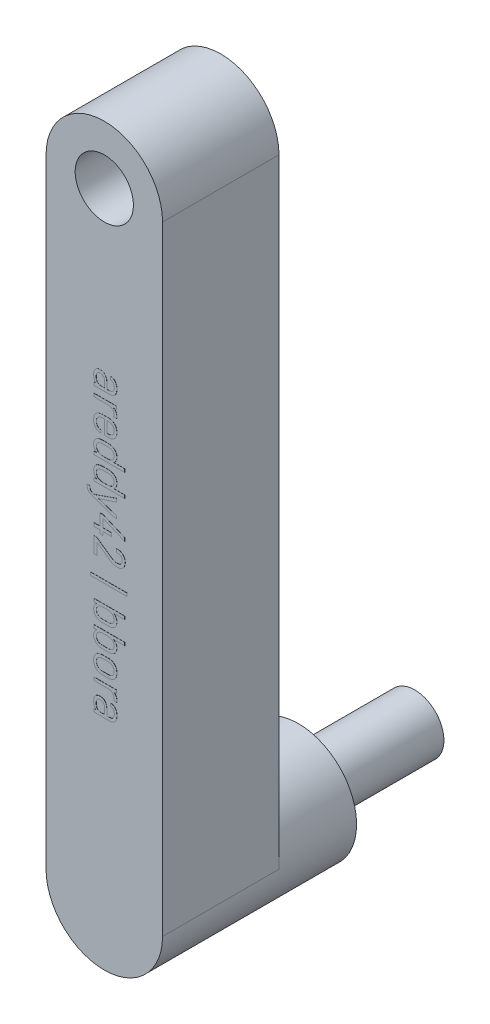
from build123d import *

# Parameters (mm, degrees)
SKETCH1_LINK2_R     = 20
BOSS_EXTRUDE1_DEPTH = 40
SKETCH2_LINK2_R     = 40
BOSS_EXTRUDE2_DEPTH = 53.3
SKETCH3_LINK2_R     = 20
BOSS_EXTRUDE3_DEPTH = 80
SKETCH1_W           = 25.175927826
SKETCH1_H           = 2.04955913
BOSS_EXTRUDE4_DEPTH = 0.1


with BuildPart() as part:
    # sketch1_link2 → Boss-Extrude1 (new, symmetric)
    with BuildSketch(Plane.XY):
        Circle(SKETCH1_LINK2_R)
    extrude(amount=BOSS_EXTRUDE1_DEPTH, both=True)

    # sketch2_link2 → Boss-Extrude2 (add)
    with BuildSketch(Plane.XY.offset(40)):
        Circle(SKETCH2_LINK2_R)
    extrude(amount=BOSS_EXTRUDE2_DEPTH)

    # sketch3_link2 → Boss-Extrude3 (add)
    with BuildSketch(Plane.XY.offset(93.3)):
        with BuildLine():
            Line((-40, 0), (-40, 425))
            ThreePointArc((-40, 425), (0, 465), (40, 425))
            Line((40, 425), (40, 0))
            ThreePointArc((40, 0), (0, -40), (-40, 0))
        make_face()
        with Locations((0, 425)):
            Circle(SKETCH3_LINK2_R, mode=Mode.SUBTRACT)
    extrude(amount=BOSS_EXTRUDE3_DEPTH)

    # Sketch1 → Boss-Extrude4 (add)
    # profile 1 of 14: a face of its own
    with BuildSketch(Plane.XY.offset(173.3)):
        with BuildLine():
            add(Edge.make_bspline(
                [(7.408094783, 305.842787451), (7.513961073, 305.96644743), (7.728598293, 306.217160231), (7.989139603, 306.646478423), (8.218468955, 307.110513084), (8.402866761, 307.615172808), (8.543773864, 308.159429604), (8.644701655, 308.742583042), (8.706893474, 309.365361301), (8.7154492, 309.794365313), (8.719835791, 310.014319209)],
                knots=[0, 0, 0, 0, 0.872211868, 1.768354495, 2.685268479, 3.646978331, 4.645387769, 5.698233651, 6.819865405, 8, 8, 8, 8], degree=3))
            add(Edge.make_bspline(
                [(8.719835791, 310.014319209), (8.717057747, 310.218051215), (8.711650755, 310.614580924), (8.651763336, 311.19270099), (8.559504357, 311.738409279), (8.434602809, 312.252208934), (8.263451035, 312.729552055), (8.060232064, 313.175166699), (7.818462668, 313.588969345), (7.625038465, 313.838516662), (7.529341471, 313.961980674)],
                knots=[0, 0, 0, 0, 1.161952125, 2.261542236, 3.311740008, 4.318090457, 5.273751269, 6.200168062, 7.109529703, 8, 8, 8, 8], degree=3))
            add(Edge.make_bspline(
                [(7.529341471, 313.961980674), (7.428634778, 314.076592632), (7.229820715, 314.302858321), (6.889756939, 314.595878172), (6.52557092, 314.844273971), (6.139204669, 315.050701701), (5.724746816, 315.205423562), (5.28791968, 315.321358074), (4.82436904, 315.387882269), (4.508318602, 315.396115839), (4.347313899, 315.400310244)],
                knots=[0, 0, 0, 0, 1.012152513, 1.998180554, 2.97088328, 3.934915363, 4.899146504, 5.901821412, 6.931130673, 8, 8, 8, 8], degree=3))
            Line((4.347313899, 315.400310244), (4.19609913, 315.40229832))
            Line((4.19609913, 315.40229832), (4.19609913, 313.383329624))
            Line((4.19609913, 313.383329624), (4.287870435, 313.383329624))
            add(Edge.make_bspline(
                [(4.287870435, 313.383329624), (4.388995566, 313.380811032), (4.587195377, 313.375874728), (4.875533817, 313.330074902), (5.148204675, 313.258728733), (5.406720267, 313.162885997), (5.646440443, 313.032692011), (5.86911031, 312.876829303), (6.076526367, 312.693342646), (6.197396789, 312.551767902), (6.25918582, 312.47939481)],
                knots=[0, 0, 0, 0, 1.079388384, 2.115543102, 3.109137989, 4.086485665, 5.05220772, 6.013808244, 6.98465761, 8, 8, 8, 8], degree=3))
            add(Edge.make_bspline(
                [(6.25918582, 312.47939481), (6.370957915, 312.318029167), (6.601218908, 311.985600819), (6.820746597, 311.390407242), (6.954616319, 310.716746686), (6.968712174, 310.23928796), (6.97613779, 309.987765432)],
                knots=[0, 0, 0, 0, 0.889317695, 1.832077797, 2.857950978, 4, 4, 4, 4], degree=3))
            add(Edge.make_bspline(
                [(6.97613779, 309.987765432), (6.973752502, 309.850468154), (6.969125074, 309.584113194), (6.928836265, 309.1978966), (6.862971503, 308.836567603), (6.769774254, 308.498919408), (6.651642558, 308.181516629), (6.499507703, 307.891369731), (6.328831958, 307.620962722), (6.190525796, 307.463514982), (6.121991307, 307.385495318)],
                knots=[0, 0, 0, 0, 1.174492562, 2.278500503, 3.318297138, 4.313546514, 5.272349519, 6.209471412, 7.112744078, 8, 8, 8, 8], degree=3))
            add(Edge.make_bspline(
                [(6.121991307, 307.385495318), (6.048821915, 307.310860233), (5.901567297, 307.160655884), (5.641932568, 306.977405984), (5.360794568, 306.821688563), (5.055620765, 306.691670176), (4.723541454, 306.58985104), (4.364224208, 306.522048515), (3.981228014, 306.474988646), (3.717553839, 306.47129394), (3.581680005, 306.469390023)],
                knots=[0, 0, 0, 0, 0.900994961, 1.813267341, 2.73139166, 3.673163286, 4.672540088, 5.724373991, 6.827348073, 8, 8, 8, 8], degree=3))
            Line((3.581680005, 306.469390023), (1.810045217, 306.469891364))
            Line((1.810045217, 306.469891364), (1.810045217, 310.660780929))
            add(Edge.make_bspline(
                [(1.810045217, 310.660780929), (1.806126202, 310.861477917), (1.79849996, 311.252025976), (1.737687928, 311.819188157), (1.653403803, 312.352970628), (1.523908777, 312.852105609), (1.3575125, 313.316489796), (1.150806119, 313.745147316), (0.914640248, 314.142660403), (0.724090923, 314.380012617), (0.629785165, 314.497481837)],
                knots=[0, 0, 0, 0, 1.174717605, 2.28595199, 3.336699022, 4.335954418, 5.300411989, 6.219846068, 7.118974748, 8, 8, 8, 8], degree=3))
            add(Edge.make_bspline(
                [(0.629785165, 314.497481837), (0.528828312, 314.606075492), (0.328626079, 314.821421868), (-0.010311866, 315.100534332), (-0.376070534, 315.338860767), (-0.773234611, 315.527546573), (-1.196462033, 315.680680077), (-1.649628697, 315.785147592), (-2.130063713, 315.847486351), (-2.459112893, 315.856145211), (-2.627478108, 315.860575707)],
                knots=[0, 0, 0, 0, 0.974569255, 1.932617125, 2.880186649, 3.839462629, 4.818707954, 5.835652936, 6.892564459, 8, 8, 8, 8], degree=3))
            add(Edge.make_bspline(
                [(-2.627478108, 315.860575707), (-2.807622824, 315.856137488), (-3.158686292, 315.847488349), (-3.670152555, 315.785783788), (-4.147476337, 315.680479796), (-4.591854764, 315.534093304), (-5.002264317, 315.342951586), (-5.378826574, 315.107254555), (-5.724557504, 314.833008769), (-5.922760824, 314.618228439), (-6.021935892, 314.510758726)],
                knots=[0, 0, 0, 0, 1.145792184, 2.232903549, 3.271082709, 4.250337122, 5.203295883, 6.143275954, 7.070950301, 8, 8, 8, 8], degree=3))
            add(Edge.make_bspline(
                [(-6.021935892, 314.510758726), (-6.116510859, 314.394962422), (-6.307076575, 314.161636349), (-6.538425246, 313.767057967), (-6.739989977, 313.34411132), (-6.903103105, 312.88561601), (-7.030729537, 312.392371926), (-7.123855144, 311.864265031), (-7.175980447, 311.301764687), (-7.182523636, 310.915778054), (-7.185876437, 310.717994291)],
                knots=[0, 0, 0, 0, 0.884249297, 1.781735761, 2.700112927, 3.656276276, 4.658583548, 5.714297133, 6.828780908, 8, 8, 8, 8], degree=3))
            add(Edge.make_bspline(
                [(-7.185876437, 310.717994291), (-7.181842793, 310.477192007), (-7.174094613, 310.014637611), (-7.085636844, 309.35021516), (-6.957077377, 308.738757593), (-6.81299894, 308.363572072), (-6.743313492, 308.182108618)],
                knots=[0, 0, 0, 0, 1.114607377, 2.141036768, 3.100887774, 4, 4, 4, 4], degree=3))
            add(Edge.make_bspline(
                [(-6.743313492, 308.182108618), (-6.664314587, 308.012513084), (-6.506873575, 307.674517357), (-6.178657354, 307.217749293), (-5.799304489, 306.795081327), (-5.500494603, 306.558277962), (-5.349240217, 306.438410617)],
                knots=[0, 0, 0, 0, 0.99218601, 1.977378907, 2.976170714, 4, 4, 4, 4], degree=3))
            Line((-5.349240217, 306.438410617), (-7, 306.439300929))
            Line((-7, 306.439300929), (-7, 304.389741798))
            Line((-7, 304.389741798), (3.5537, 304.389741798))
            add(Edge.make_bspline(
                [(3.5537, 304.389741798), (3.758014771, 304.393062044), (4.157143868, 304.399548147), (4.735752679, 304.474624704), (5.279640235, 304.580426508), (5.781929815, 304.741617294), (6.24817618, 304.944854327), (6.67209198, 305.199364751), (7.065759949, 305.491543326), (7.291819439, 305.724087438), (7.405423846, 305.840950641)],
                knots=[0, 0, 0, 0, 1.155338282, 2.256954421, 3.296480794, 4.286431301, 5.235672244, 6.167616113, 7.079149977, 8, 8, 8, 8], degree=3))
            Line((7.405423846, 305.840950641), (7.408094783, 305.842787451))
        make_face()
        with BuildLine():
            add(Edge.make_bspline(
                [(-4.568060435, 307.402899624), (-4.643519451, 307.483654538), (-4.796761479, 307.647651463), (-4.986542472, 307.937248551), (-5.150696486, 308.258483388), (-5.277422067, 308.618151287), (-5.378834096, 309.009084387), (-5.453789546, 309.435120745), (-5.498122667, 309.89682822), (-5.502086253, 310.216321651), (-5.504137247, 310.381646453)],
                knots=[0, 0, 0, 0, 0.82673905, 1.678940106, 2.583502879, 3.5240172, 4.529321757, 5.606883587, 6.761659995, 8, 8, 8, 8], degree=3))
            add(Edge.make_bspline(
                [(-5.504137247, 310.381646453), (-5.50087638, 310.518874224), (-5.494556757, 310.784824269), (-5.466267355, 311.171216655), (-5.407810071, 311.530436739), (-5.329229282, 311.863771619), (-5.22723527, 312.170377139), (-5.104785773, 312.452644444), (-4.952076741, 312.703875354), (-4.784385356, 312.934590394), (-4.587555176, 313.133753077), (-4.36934837, 313.307933292), (-4.12831247, 313.454733185), (-3.865239318, 313.57454447), (-3.580125933, 313.667434178), (-3.273123989, 313.733042154), (-2.942787207, 313.773685954), (-2.714639067, 313.778194986), (-2.596498701, 313.780529867)],
                knots=[0, 0, 0, 0, 1.2862611, 2.492798612, 3.626837316, 4.69304628, 5.69846781, 6.651492719, 7.568965738, 8.448149398, 9.318156436, 10.183869836, 11.058695681, 11.955631552, 12.886749578, 13.862854453, 14.893336769, 16, 16, 16, 16], degree=3))
            add(Edge.make_bspline(
                [(-2.596498701, 313.780529867), (-2.479826043, 313.778230336), (-2.254603913, 313.773791374), (-1.927316187, 313.73253355), (-1.623058438, 313.667983394), (-1.338778527, 313.574508202), (-1.079837047, 313.45059908), (-0.84118937, 313.303574673), (-0.625589406, 313.127973608), (-0.43256923, 312.925676736), (-0.260629094, 312.695856324), (-0.117479075, 312.438491855), (0.010373359, 312.157142641), (0.103495571, 311.84491065), (0.183826419, 311.509854043), (0.242531783, 311.147602931), (0.270533031, 310.758267835), (0.276884305, 310.489370488), (0.280160438, 310.350667047)],
                knots=[0, 0, 0, 0, 1.09233738, 2.108622156, 3.084269629, 4.001833028, 4.904185692, 5.766841806, 6.621382023, 7.50091374, 8.379685415, 9.301711344, 10.254289667, 11.268129412, 12.347279137, 13.480786431, 14.700531652, 16, 16, 16, 16], degree=3))
            Line((0.280160438, 310.350667047), (0.280523478, 306.469891364))
            Line((0.280523478, 306.469891364), (-1.738445217, 306.469891364))
            add(Edge.make_bspline(
                [(-1.738445217, 306.469891364), (-1.893282883, 306.471647375), (-2.190557477, 306.475018761), (-2.621170711, 306.520178595), (-3.020390342, 306.595849815), (-3.391323002, 306.695439256), (-3.733000783, 306.8247181), (-4.043995708, 306.983770087), (-4.325635651, 307.173750106), (-4.489440551, 307.324386229), (-4.570329434, 307.398772206)],
                knots=[0, 0, 0, 0, 1.214958032, 2.332611728, 3.393201942, 4.401688958, 5.343628624, 6.255110889, 7.138352206, 8, 8, 8, 8], degree=3))
            Line((-4.570329434, 307.398772206), (-4.568060435, 307.402899624))
        make_face(mode=Mode.SUBTRACT)
    # profile 2 of 14: a face of its own
    with BuildSketch(Plane.XY.offset(173.3)):
        with BuildLine():
            Line((8.509350435, 299.709647303), (-7, 299.709647303))
            Line((-7, 299.709647303), (-7, 297.629497738))
            Line((-7, 297.629497738), (2.819529565, 297.629497738))
            add(Edge.make_bspline(
                [(2.819529565, 297.629497738), (2.962997352, 297.624261845), (3.244354493, 297.613993646), (3.657135275, 297.57338333), (4.048143865, 297.489832604), (4.421968982, 297.387457677), (4.772810465, 297.244139542), (5.100421728, 297.070170401), (5.411974197, 296.871276627), (5.59857011, 296.711713318), (5.692705251, 296.631215765)],
                knots=[0, 0, 0, 0, 1.107218333, 2.171384888, 3.193296519, 4.187212281, 5.156936421, 6.108606323, 7.04581721, 8, 8, 8, 8], degree=3))
            add(Edge.make_bspline(
                [(5.692705251, 296.631215765), (5.779963051, 296.547285842), (5.952623774, 296.381210132), (6.180288621, 296.105096221), (6.370743023, 295.807391855), (6.526671808, 295.491254667), (6.647073648, 295.157200571), (6.729784354, 294.803623824), (6.785280164, 294.431946857), (6.79151248, 294.176674233), (6.794686983, 294.046648168)],
                knots=[0, 0, 0, 0, 1.001850388, 1.982403991, 2.954783944, 3.921624978, 4.895231522, 5.887656392, 6.924053345, 8, 8, 8, 8], degree=3))
            add(Edge.make_bspline(
                [(6.794686983, 294.046648168), (6.793136554, 293.906308132), (6.790090911, 293.630626005), (6.736320914, 293.225949959), (6.665262829, 292.834098591), (6.589086486, 292.582650258), (6.551277363, 292.457847197)],
                knots=[0, 0, 0, 0, 1.042585884, 2.048042038, 3.031171432, 4, 4, 4, 4], degree=3))
            Line((6.551277363, 292.457847197), (8.631712174, 292.45971426))
            add(Edge.make_bspline(
                [(8.631712174, 292.45971426), (8.657365273, 292.644681533), (8.709408991, 293.019933839), (8.71632751, 293.398727521), (8.719835791, 293.590808335)],
                knots=[0, 0, 0, 0, 0.98582884, 2, 2, 2, 2], degree=3))
            add(Edge.make_bspline(
                [(8.719835791, 293.590808335), (8.713472341, 293.805222952), (8.701014238, 294.22499516), (8.590149328, 294.836933822), (8.417045917, 295.419215397), (8.241064642, 295.779135294), (8.153355222, 295.958520089)],
                knots=[0, 0, 0, 0, 1.04574956, 2.047325917, 3.026783339, 4, 4, 4, 4], degree=3))
            add(Edge.make_bspline(
                [(8.153355222, 295.958520089), (8.052515556, 296.130478332), (7.850434883, 296.475079207), (7.446267226, 296.927965059), (6.974322037, 297.333482085), (6.612473642, 297.548144893), (6.427359739, 297.657961796)],
                knots=[0, 0, 0, 0, 0.97193937, 1.947747038, 2.950111253, 4, 4, 4, 4], degree=3))
            Line((6.427359739, 297.657961796), (8.509350435, 297.660088173))
            Line((8.509350435, 297.660088173), (8.509350435, 299.709647303))
        make_face()
    # profile 3 of 14: a face of its own
    with BuildSketch(Plane.XY.offset(173.3)):
        with BuildLine():
            Line((0.341704348, 287.922294451), (0.341704348, 278.225126625))
            Line((0.341704348, 278.225126625), (2.177130435, 278.225126625))
            add(Edge.make_bspline(
                [(2.177130435, 278.225126625), (2.444873018, 278.230247774), (2.966160447, 278.240218508), (3.719646029, 278.315685675), (4.422213772, 278.437129065), (5.067090467, 278.615105653), (5.665078706, 278.834010576), (6.202326004, 279.113658977), (6.692199838, 279.43756989), (6.973455273, 279.697720041), (7.113332303, 279.827100759)],
                knots=[0, 0, 0, 0, 1.206863888, 2.349730716, 3.410357768, 4.417134827, 5.362111979, 6.275287241, 7.142246986, 8, 8, 8, 8], degree=3))
            add(Edge.make_bspline(
                [(7.113332303, 279.827100759), (7.241884571, 279.963064475), (7.498262693, 280.234223613), (7.826190653, 280.689270267), (8.1007944, 281.1789471), (8.327016993, 281.699542175), (8.506420061, 282.251810587), (8.627092124, 282.838226585), (8.70479175, 283.456991767), (8.71473928, 283.880733573), (8.719835791, 284.097833174)],
                knots=[0, 0, 0, 0, 0.957337825, 1.909265989, 2.863110468, 3.827249066, 4.811479094, 5.83079793, 6.888632423, 8, 8, 8, 8], degree=3))
            add(Edge.make_bspline(
                [(8.719835791, 284.097833174), (8.714739615, 284.314933001), (8.704792739, 284.738675246), (8.627088449, 285.35743729), (8.506433113, 285.943864545), (8.32697047, 286.496092864), (8.100963533, 287.016833076), (7.824979259, 287.507020229), (7.498509128, 287.965828296), (7.241942782, 288.239987498), (7.113332303, 288.377416848)],
                knots=[0, 0, 0, 0, 1.109738897, 2.166023161, 3.183848212, 4.166635877, 5.129361555, 6.081808199, 7.038457032, 8, 8, 8, 8], degree=3))
            add(Edge.make_bspline(
                [(7.113332303, 288.377416848), (6.973191966, 288.507808541), (6.690907529, 288.770456299), (6.205306161, 289.10576897), (5.663689134, 289.381986927), (5.068345176, 289.609008134), (4.421492734, 289.783199156), (3.720274936, 289.912775797), (2.96512796, 289.985991886), (2.44297259, 289.996312844), (2.174329841, 290.001622855)],
                knots=[0, 0, 0, 0, 0.860035408, 1.732367822, 2.64330265, 3.588316332, 4.592623309, 5.651833111, 6.791895967, 8, 8, 8, 8], degree=3))
            Line((2.174329841, 290.001622855), (-0.514827826, 290.002444017))
            add(Edge.make_bspline(
                [(-0.514827826, 290.002444017), (-0.791390956, 289.99685436), (-1.327337269, 289.986022272), (-2.102051553, 289.912547832), (-2.819787275, 289.784031528), (-3.481905893, 289.60747082), (-4.091319294, 289.385598772), (-4.641161085, 289.102742733), (-5.138197624, 288.773563465), (-5.424756358, 288.508268564), (-5.56609606, 288.377416848)],
                knots=[0, 0, 0, 0, 1.21942452, 2.36309907, 3.427203224, 4.430714964, 5.381598037, 6.280513394, 7.1518956, 8, 8, 8, 8], degree=3))
            add(Edge.make_bspline(
                [(-5.56609606, 288.377416848), (-5.696716597, 288.240401233), (-5.957443596, 287.966909247), (-6.281035355, 287.500881045), (-6.563802426, 287.00937286), (-6.788871419, 286.479317171), (-6.972995836, 285.919321501), (-7.09327801, 285.320457719), (-7.170813057, 284.689961123), (-7.180774814, 284.257398584), (-7.185876437, 284.035874362)],
                knots=[0, 0, 0, 0, 0.953235306, 1.90271902, 2.852144452, 3.808393582, 4.801126171, 5.819448137, 6.883294292, 8, 8, 8, 8], degree=3))
            add(Edge.make_bspline(
                [(-7.185876437, 284.035874362), (-7.181458704, 283.820346282), (-7.172816244, 283.39870633), (-7.110525307, 282.784766539), (-7.009168117, 282.206219884), (-6.869339707, 281.663077504), (-6.682208866, 281.156818683), (-6.457045385, 280.686291842), (-6.190508024, 280.249698689), (-5.977800068, 279.988604615), (-5.871464491, 279.858080165)],
                knots=[0, 0, 0, 0, 1.155819568, 2.261142527, 3.305667661, 4.303575538, 5.264802267, 6.19548923, 7.09790072, 8, 8, 8, 8], degree=3))
            add(Edge.make_bspline(
                [(-5.871464491, 279.858080165), (-5.760497595, 279.737386795), (-5.540255283, 279.497839798), (-5.167885968, 279.189701218), (-4.768305743, 278.928556135), (-4.342449281, 278.717866225), (-3.891407609, 278.545770389), (-3.41270507, 278.428942459), (-2.907126081, 278.355166316), (-2.561362032, 278.348125259), (-2.384068488, 278.344514895)],
                knots=[0, 0, 0, 0, 1.00099106, 1.986723901, 2.944396484, 3.911989026, 4.88481693, 5.888402706, 6.917259995, 8, 8, 8, 8], degree=3))
            Line((-2.384068488, 278.344514895), (-2.227892174, 278.347488364))
            Line((-2.227892174, 278.347488364), (-2.227892174, 280.36645706))
            Line((-2.227892174, 280.36645706), (-2.319663478, 280.36645706))
            add(Edge.make_bspline(
                [(-2.319663478, 280.36645706), (-2.434236302, 280.366887301), (-2.657622141, 280.367726153), (-2.983167159, 280.414389972), (-3.288753096, 280.488514946), (-3.575165266, 280.59345171), (-3.847581673, 280.7165043), (-4.091231289, 280.887857944), (-4.3239112, 281.074281748), (-4.458546238, 281.222213699), (-4.52607314, 281.296409735)],
                knots=[0, 0, 0, 0, 1.109230385, 2.16269752, 3.178728053, 4.151065338, 5.11675751, 6.064501626, 7.02924076, 8, 8, 8, 8], degree=3))
            add(Edge.make_bspline(
                [(-4.52607314, 281.296409735), (-4.590298762, 281.375979647), (-4.720261093, 281.536991574), (-4.874892782, 281.809947002), (-5.01682447, 282.099154072), (-5.123334788, 282.414072291), (-5.214906095, 282.748861395), (-5.274626098, 283.106177594), (-5.310203179, 283.486367631), (-5.315517959, 283.746650548), (-5.318260811, 283.880977331)],
                knots=[0, 0, 0, 0, 0.887828859, 1.796546355, 2.720442374, 3.686148807, 4.681979173, 5.736569537, 6.831889024, 8, 8, 8, 8], degree=3))
            add(Edge.make_bspline(
                [(-5.318260811, 283.880977331), (-5.314721689, 284.034547791), (-5.307795367, 284.335096467), (-5.258054623, 284.771475431), (-5.18167516, 285.184924744), (-5.058452653, 285.567892095), (-4.915749738, 285.931114839), (-4.729795736, 286.263593942), (-4.521564904, 286.577730415), (-4.350298143, 286.759836591), (-4.264961002, 286.850574689)],
                knots=[0, 0, 0, 0, 1.139584004, 2.23024964, 3.256697853, 4.254119373, 5.211804485, 6.147709669, 7.077058743, 8, 8, 8, 8], degree=3))
            add(Edge.make_bspline(
                [(-4.264961002, 286.850574689), (-4.171666117, 286.937931703), (-3.979878589, 287.117512668), (-3.633623251, 287.330384361), (-3.24215592, 287.512408954), (-2.805959562, 287.668048429), (-2.316909099, 287.779909741), (-1.78171792, 287.864006247), (-1.195881723, 287.911054338), (-0.789446577, 287.917980643), (-0.578411674, 287.921577015)],
                knots=[0, 0, 0, 0, 0.77801111, 1.599367713, 2.464893713, 3.409864203, 4.418309161, 5.520568616, 6.712595193, 8, 8, 8, 8], degree=3))
            Line((-0.578411674, 287.921577015), (0.341704348, 287.922294451))
        make_face()
        with BuildLine():
            add(Edge.make_bspline(
                [(5.802096957, 286.882219669), (5.882065081, 286.793224237), (6.042495983, 286.614682883), (6.25887353, 286.324254748), (6.426630806, 286.001015213), (6.577933407, 285.664825769), (6.684338225, 285.3021899), (6.773101521, 284.921852362), (6.813135632, 284.516150013), (6.821422697, 284.23950121), (6.825666389, 284.097833174)],
                knots=[0, 0, 0, 0, 0.943201374, 1.892237021, 2.844473471, 3.808004447, 4.793804908, 5.818022677, 6.882639516, 8, 8, 8, 8], degree=3))
            add(Edge.make_bspline(
                [(6.825666389, 284.097833174), (6.824125598, 283.953086153), (6.821128732, 283.671550404), (6.768962529, 283.263517754), (6.69504661, 282.878216103), (6.58983635, 282.516110229), (6.452798618, 282.177382828), (6.282369001, 281.865075193), (6.083688499, 281.574168692), (5.926410441, 281.400921934), (5.847602281, 281.314112253)],
                knots=[0, 0, 0, 0, 1.146755063, 2.230460731, 3.255789471, 4.255104975, 5.215112127, 6.14669776, 7.071355914, 8, 8, 8, 8], degree=3))
            add(Edge.make_bspline(
                [(5.847602281, 281.314112253), (5.759470835, 281.233679274), (5.579383708, 281.069323137), (5.265336302, 280.858952962), (4.903029841, 280.6886643), (4.497937028, 280.547190893), (4.048699534, 280.43818567), (3.554680113, 280.357939586), (3.015885968, 280.317035706), (2.642028297, 280.30914748), (2.448718867, 280.305068739)],
                knots=[0, 0, 0, 0, 0.7869794, 1.60810772, 2.483627973, 3.423059136, 4.436365535, 5.531496832, 6.723618704, 8, 8, 8, 8], degree=3))
            Line((2.448718867, 280.305068739), (1.901816522, 280.305276191))
            Line((1.901816522, 280.305276191), (1.901816522, 287.922294451))
            Line((1.901816522, 287.922294451), (2.238311304, 287.922294451))
            add(Edge.make_bspline(
                [(2.238311304, 287.922294451), (2.441322397, 287.918498545), (2.833868912, 287.911158702), (3.397879964, 287.862688058), (3.916451899, 287.785586633), (4.386916789, 287.669772182), (4.812461866, 287.527033001), (5.190078611, 287.348065296), (5.522048045, 287.138199926), (5.708282081, 286.965570932), (5.798920357, 286.881554096)],
                knots=[0, 0, 0, 0, 1.28155473, 2.478041164, 3.571304096, 4.587768927, 5.533187245, 6.399667436, 7.221133852, 8, 8, 8, 8], degree=3))
            Line((5.798920357, 286.881554096), (5.802096957, 286.882219669))
        make_face(mode=Mode.SUBTRACT)
    # profile 4 of 14: a face of its own
    with BuildSketch(Plane.XY.offset(173.3)):
        with BuildLine():
            add(Edge.make_bspline(
                [(-5.638725652, 273.239127782), (-5.763553748, 273.114345648), (-6.009747229, 272.868242814), (-6.323245452, 272.456622204), (-6.592375334, 272.024948711), (-6.811007001, 271.564891498), (-6.978571587, 271.077570444), (-7.095920793, 270.565592641), (-7.176616795, 270.029832933), (-7.182741377, 269.66321723), (-7.185876437, 269.475553485)],
                knots=[0, 0, 0, 0, 1.010093325, 1.992166833, 2.956037266, 3.919944744, 4.903435255, 5.901700752, 6.925919726, 8, 8, 8, 8], degree=3))
            add(Edge.make_bspline(
                [(-7.185876437, 269.475553485), (-7.179605305, 269.239044706), (-7.167426289, 268.779726606), (-7.058375993, 268.117549437), (-6.887461519, 267.502863048), (-6.707518138, 267.130750736), (-6.619395868, 266.948519072)],
                knots=[0, 0, 0, 0, 1.084609622, 2.106394663, 3.072659406, 4, 4, 4, 4], degree=3))
            add(Edge.make_bspline(
                [(-6.619395868, 266.948519072), (-6.518107793, 266.778363953), (-6.317115277, 266.440714083), (-5.926592553, 265.993506244), (-5.47404886, 265.597949376), (-5.127105528, 265.390050126), (-4.950933567, 265.2844824)],
                knots=[0, 0, 0, 0, 0.993296889, 1.971063628, 2.969740392, 4, 4, 4, 4], degree=3))
            Line((-4.950933567, 265.2844824), (-7, 265.285614739))
            Line((-7, 265.285614739), (-7, 263.174874739))
            Line((-7, 263.174874739), (14.1074, 263.174874739))
            Line((14.1074, 263.174874739), (14.1074, 265.285614739))
            Line((14.1074, 265.285614739), (6.337429565, 265.285614739))
            add(Edge.make_bspline(
                [(6.337429565, 265.285614739), (6.525484216, 265.400082138), (6.894430706, 265.624656989), (7.382668184, 266.033564827), (7.794753214, 266.49079849), (8.136558862, 266.990765225), (8.399042938, 267.540531812), (8.582946157, 268.135545794), (8.703787121, 268.774383523), (8.714381742, 269.216813643), (8.719835791, 269.444574079)],
                knots=[0, 0, 0, 0, 1.045588967, 2.051352509, 3.014748921, 3.96405186, 4.920838886, 5.899056288, 6.918446478, 8, 8, 8, 8], degree=3))
            add(Edge.make_bspline(
                [(8.719835791, 269.444574079), (8.716656926, 269.633711333), (8.710421262, 270.004723062), (8.629602413, 270.547731197), (8.514116946, 271.066175941), (8.343924601, 271.557078724), (8.126352881, 272.020337084), (7.858522853, 272.455995988), (7.54410134, 272.867237065), (7.299136887, 273.113059151), (7.175291115, 273.237338514)],
                knots=[0, 0, 0, 0, 1.075724565, 2.110141823, 3.118494694, 4.095807301, 5.061249936, 6.026217658, 7.002122163, 8, 8, 8, 8], degree=3))
            add(Edge.make_bspline(
                [(7.175291115, 273.237338514), (7.041251308, 273.356518425), (6.768732626, 273.59882519), (6.291605137, 273.891704045), (5.767764687, 274.143802441), (5.190450314, 274.354894825), (4.557553835, 274.509384022), (3.872688601, 274.623707803), (3.134774154, 274.696362434), (2.62444588, 274.703138799), (2.360206278, 274.70664749)],
                knots=[0, 0, 0, 0, 0.833793777, 1.695200749, 2.595394803, 3.538518663, 4.551479748, 5.624324203, 6.769914075, 8, 8, 8, 8], degree=3))
            Line((2.360206278, 274.70664749), (-0.820732174, 274.707468652))
            add(Edge.make_bspline(
                [(-0.820732174, 274.707468652), (-1.085332148, 274.703573019), (-1.597479918, 274.696032807), (-2.33723884, 274.623920705), (-3.022356902, 274.510209877), (-3.654465563, 274.353163575), (-4.232735026, 274.144928183), (-4.757601002, 273.891573925), (-5.23478385, 273.598855928), (-5.507295441, 273.356528559), (-5.64133176, 273.237338514)],
                knots=[0, 0, 0, 0, 1.230525912, 2.381750426, 3.453474799, 4.458725214, 5.407314865, 6.306569091, 7.167076728, 8, 8, 8, 8], degree=3))
            Line((-5.64133176, 273.237338514), (-5.638725652, 273.239127782))
        make_face()
        with BuildLine():
            add(Edge.make_bspline(
                [(-4.032727826, 266.264508652), (-4.136180933, 266.348252775), (-4.340429927, 266.513590034), (-4.602760249, 266.806474738), (-4.82749343, 267.125968925), (-5.002334581, 267.480245484), (-5.146396971, 267.858885448), (-5.248322293, 268.26868885), (-5.304061531, 268.709856966), (-5.313432657, 269.013660593), (-5.318260811, 269.170185054)],
                knots=[0, 0, 0, 0, 0.966570576, 1.908314551, 2.848713264, 3.798670543, 4.77302954, 5.790380138, 6.861568701, 8, 8, 8, 8], degree=3))
            add(Edge.make_bspline(
                [(-5.318260811, 269.170185054), (-5.31500531, 269.309002923), (-5.308710964, 269.577400305), (-5.256016504, 269.968254631), (-5.160921906, 270.330336505), (-5.040986048, 270.670748949), (-4.871925506, 270.978900534), (-4.674964571, 271.264200483), (-4.434686119, 271.517978531), (-4.165660958, 271.750252734), (-3.85582437, 271.948981131), (-3.512153693, 272.123490501), (-3.129459306, 272.266253699), (-2.713562554, 272.392501376), (-2.259722271, 272.482668241), (-1.771984744, 272.548510137), (-1.248824038, 272.588586871), (-0.888277524, 272.593228415), (-0.702329299, 272.595622245)],
                knots=[0, 0, 0, 0, 1.016798337, 1.965928533, 2.880720247, 3.75603862, 4.602182781, 5.447705564, 6.288865848, 7.155130695, 8.045399287, 8.978207285, 9.973704497, 11.033694235, 12.159151225, 13.358947719, 14.637903948, 16, 16, 16, 16], degree=3))
            Line((-0.702329299, 272.595622245), (2.238311304, 272.596728652))
            add(Edge.make_bspline(
                [(2.238311304, 272.596728652), (2.423638553, 272.594477948), (2.782253525, 272.590122755), (3.301196625, 272.542284433), (3.786968071, 272.47984989), (4.236527412, 272.382203882), (4.65221856, 272.259835314), (5.029947509, 272.10449607), (5.371202002, 271.921942461), (5.683363829, 271.719288968), (5.951481732, 271.479300665), (6.186107758, 271.213368044), (6.386859794, 270.921934355), (6.544531401, 270.598120122), (6.676755786, 270.251287079), (6.76162983, 269.872746108), (6.816421365, 269.468320793), (6.822527655, 269.189556768), (6.825666389, 269.046267429)],
                knots=[0, 0, 0, 0, 1.342710938, 2.598194534, 3.774567381, 4.890193602, 5.928605305, 6.9114231, 7.84411238, 8.730745947, 9.601770837, 10.442613054, 11.296674327, 12.157335398, 13.047057841, 13.980665876, 14.962028722, 16, 16, 16, 16], degree=3))
            add(Edge.make_bspline(
                [(6.825666389, 269.046267429), (6.820752652, 268.895659981), (6.811177608, 268.602182136), (6.756173365, 268.175403106), (6.652073507, 267.778303841), (6.51308351, 267.407324333), (6.322563812, 267.070116006), (6.102158745, 266.755465137), (5.833151813, 266.474383772), (5.628371152, 266.313266279), (5.524531332, 266.231567101)],
                knots=[0, 0, 0, 0, 1.120328079, 2.183102335, 3.191547393, 4.167423017, 5.120020786, 6.063733372, 7.018161302, 8, 8, 8, 8], degree=3))
            add(Edge.make_bspline(
                [(5.524531332, 266.231567101), (5.412090053, 266.156000845), (5.185677162, 266.003839869), (4.820433902, 265.80603126), (4.42354485, 265.649685313), (4.002051984, 265.516687722), (3.552785877, 265.409304281), (3.076183445, 265.336271158), (2.572067939, 265.290436075), (2.227541792, 265.286503986), (2.050412217, 265.2844824)],
                knots=[0, 0, 0, 0, 0.887993514, 1.788072686, 2.716646774, 3.680225103, 4.684310632, 5.741761569, 6.83898271, 8, 8, 8, 8], degree=3))
            Line((2.050412217, 265.2844824), (-0.66778, 265.285614739))
            add(Edge.make_bspline(
                [(-0.66778, 265.285614739), (-0.838774006, 265.286656885), (-1.171483769, 265.288684628), (-1.655717853, 265.341606383), (-2.114621975, 265.414617651), (-2.54857562, 265.520325925), (-2.958667804, 265.658234162), (-3.344056165, 265.826149185), (-3.705852207, 266.024114836), (-3.925726396, 266.183472845), (-4.034828271, 266.262546508)],
                knots=[0, 0, 0, 0, 1.148876565, 2.235414328, 3.270774408, 4.271446766, 5.234296896, 6.175867085, 7.094862736, 8, 8, 8, 8], degree=3))
            Line((-4.034828271, 266.262546508), (-4.032727826, 266.264508652))
        make_face(mode=Mode.SUBTRACT)
    # profile 5 of 14: a face of its own
    with BuildSketch(Plane.XY.offset(173.3)):
        with BuildLine():
            add(Edge.make_bspline(
                [(-5.638725652, 257.660912133), (-5.763553748, 257.536129999), (-6.009747229, 257.290027165), (-6.323245452, 256.878406555), (-6.592375334, 256.446733062), (-6.811007001, 255.986675849), (-6.978571587, 255.499354795), (-7.095920793, 254.987376992), (-7.176616795, 254.451617283), (-7.182741377, 254.085001581), (-7.185876437, 253.897337836)],
                knots=[0, 0, 0, 0, 1.010093325, 1.992166833, 2.956037266, 3.919944744, 4.903435255, 5.901700752, 6.925919726, 8, 8, 8, 8], degree=3))
            add(Edge.make_bspline(
                [(-7.185876437, 253.897337836), (-7.179605305, 253.660829057), (-7.167426289, 253.201510957), (-7.058375993, 252.539333788), (-6.887461519, 251.924647399), (-6.707518138, 251.552535087), (-6.619395868, 251.370303422)],
                knots=[0, 0, 0, 0, 1.084609622, 2.106394663, 3.072659406, 4, 4, 4, 4], degree=3))
            add(Edge.make_bspline(
                [(-6.619395868, 251.370303422), (-6.518107793, 251.200148304), (-6.317115277, 250.862498434), (-5.926592553, 250.415290595), (-5.47404886, 250.019733726), (-5.127105528, 249.811834477), (-4.950933567, 249.706266751)],
                knots=[0, 0, 0, 0, 0.993296889, 1.971063628, 2.969740392, 4, 4, 4, 4], degree=3))
            Line((-4.950933567, 249.706266751), (-7, 249.70739909))
            Line((-7, 249.70739909), (-7, 247.59665909))
            Line((-7, 247.59665909), (14.1074, 247.59665909))
            Line((14.1074, 247.59665909), (14.1074, 249.70739909))
            Line((14.1074, 249.70739909), (6.337429565, 249.70739909))
            add(Edge.make_bspline(
                [(6.337429565, 249.70739909), (6.525484216, 249.821866489), (6.894430706, 250.04644134), (7.382668184, 250.455349177), (7.794753214, 250.912582841), (8.136558862, 251.412549576), (8.399042938, 251.962316162), (8.582946157, 252.557330144), (8.703787121, 253.196167873), (8.714381742, 253.638597994), (8.719835791, 253.86635843)],
                knots=[0, 0, 0, 0, 1.045588967, 2.051352509, 3.014748921, 3.96405186, 4.920838886, 5.899056288, 6.918446478, 8, 8, 8, 8], degree=3))
            add(Edge.make_bspline(
                [(8.719835791, 253.86635843), (8.716656926, 254.055495684), (8.710421262, 254.426507412), (8.629602413, 254.969515548), (8.514116946, 255.487960292), (8.343924601, 255.978863074), (8.126352881, 256.442121435), (7.858522853, 256.877780339), (7.54410134, 257.289021416), (7.299136887, 257.534843502), (7.175291115, 257.659122865)],
                knots=[0, 0, 0, 0, 1.075724565, 2.110141823, 3.118494694, 4.095807301, 5.061249936, 6.026217658, 7.002122163, 8, 8, 8, 8], degree=3))
            add(Edge.make_bspline(
                [(7.175291115, 257.659122865), (7.041251308, 257.778302775), (6.768732626, 258.020609541), (6.291605137, 258.313488396), (5.767764687, 258.565586792), (5.190450314, 258.776679176), (4.557553835, 258.931168373), (3.872688601, 259.045492154), (3.134774154, 259.118146785), (2.62444588, 259.12492315), (2.360206278, 259.128431841)],
                knots=[0, 0, 0, 0, 0.833793777, 1.695200749, 2.595394803, 3.538518663, 4.551479748, 5.624324203, 6.769914075, 8, 8, 8, 8], degree=3))
            Line((2.360206278, 259.128431841), (-0.820732174, 259.129253003))
            add(Edge.make_bspline(
                [(-0.820732174, 259.129253003), (-1.085332148, 259.12535737), (-1.597479918, 259.117817158), (-2.33723884, 259.045705056), (-3.022356902, 258.931994228), (-3.654465563, 258.774947926), (-4.232735026, 258.566712534), (-4.757601002, 258.313358276), (-5.23478385, 258.020640279), (-5.507295441, 257.778312909), (-5.64133176, 257.659122865)],
                knots=[0, 0, 0, 0, 1.230525912, 2.381750426, 3.453474799, 4.458725214, 5.407314865, 6.306569091, 7.167076728, 8, 8, 8, 8], degree=3))
            Line((-5.64133176, 257.659122865), (-5.638725652, 257.660912133))
        make_face()
        with BuildLine():
            add(Edge.make_bspline(
                [(-4.032727826, 250.686293003), (-4.136180933, 250.770037126), (-4.340429927, 250.935374385), (-4.602760249, 251.228259088), (-4.82749343, 251.547753276), (-5.002334581, 251.902029835), (-5.146396971, 252.280669799), (-5.248322293, 252.690473201), (-5.304061531, 253.131641317), (-5.313432657, 253.435444944), (-5.318260811, 253.591969404)],
                knots=[0, 0, 0, 0, 0.966570576, 1.908314551, 2.848713264, 3.798670543, 4.77302954, 5.790380138, 6.861568701, 8, 8, 8, 8], degree=3))
            add(Edge.make_bspline(
                [(-5.318260811, 253.591969404), (-5.31500531, 253.730787274), (-5.308710964, 253.999184656), (-5.256016504, 254.390038982), (-5.160921906, 254.752120856), (-5.040986048, 255.0925333), (-4.871925506, 255.400684885), (-4.674964571, 255.685984833), (-4.434686119, 255.939762882), (-4.165660958, 256.172037085), (-3.85582437, 256.370765481), (-3.512153693, 256.545274852), (-3.129459306, 256.68803805), (-2.713562554, 256.814285727), (-2.259722271, 256.904452591), (-1.771984744, 256.970294488), (-1.248824038, 257.010371222), (-0.888277524, 257.015012766), (-0.702329299, 257.017406595)],
                knots=[0, 0, 0, 0, 1.016798337, 1.965928533, 2.880720247, 3.75603862, 4.602182781, 5.447705564, 6.288865848, 7.155130695, 8.045399287, 8.978207285, 9.973704497, 11.033694235, 12.159151225, 13.358947719, 14.637903948, 16, 16, 16, 16], degree=3))
            Line((-0.702329299, 257.017406595), (2.238311304, 257.018513003))
            add(Edge.make_bspline(
                [(2.238311304, 257.018513003), (2.423638553, 257.016262299), (2.782253525, 257.011907106), (3.301196625, 256.964068784), (3.786968071, 256.901634241), (4.236527412, 256.803988233), (4.65221856, 256.681619665), (5.029947509, 256.526280421), (5.371202002, 256.343726812), (5.683363829, 256.141073319), (5.951481732, 255.901085015), (6.186107758, 255.635152395), (6.386859794, 255.343718706), (6.544531401, 255.019904473), (6.676755786, 254.67307143), (6.76162983, 254.294530459), (6.816421365, 253.890105144), (6.822527655, 253.611341119), (6.825666389, 253.46805178)],
                knots=[0, 0, 0, 0, 1.342710938, 2.598194534, 3.774567381, 4.890193602, 5.928605305, 6.9114231, 7.84411238, 8.730745947, 9.601770837, 10.442613054, 11.296674327, 12.157335398, 13.047057841, 13.980665876, 14.962028722, 16, 16, 16, 16], degree=3))
            add(Edge.make_bspline(
                [(6.825666389, 253.46805178), (6.820752652, 253.317444332), (6.811177608, 253.023966487), (6.756173365, 252.597187457), (6.652073507, 252.200088192), (6.51308351, 251.829108684), (6.322563812, 251.491900357), (6.102158745, 251.177249488), (5.833151813, 250.896168123), (5.628371152, 250.735050629), (5.524531332, 250.653351452)],
                knots=[0, 0, 0, 0, 1.120328079, 2.183102335, 3.191547393, 4.167423017, 5.120020786, 6.063733372, 7.018161302, 8, 8, 8, 8], degree=3))
            add(Edge.make_bspline(
                [(5.524531332, 250.653351452), (5.412090053, 250.577785196), (5.185677162, 250.42562422), (4.820433902, 250.227815611), (4.42354485, 250.071469664), (4.002051984, 249.938472072), (3.552785877, 249.831088632), (3.076183445, 249.758055509), (2.572067939, 249.712220426), (2.227541792, 249.708288337), (2.050412217, 249.706266751)],
                knots=[0, 0, 0, 0, 0.887993514, 1.788072686, 2.716646774, 3.680225103, 4.684310632, 5.741761569, 6.83898271, 8, 8, 8, 8], degree=3))
            Line((2.050412217, 249.706266751), (-0.66778, 249.70739909))
            add(Edge.make_bspline(
                [(-0.66778, 249.70739909), (-0.838774006, 249.708441235), (-1.171483769, 249.710468979), (-1.655717853, 249.763390733), (-2.114621975, 249.836402002), (-2.54857562, 249.942110276), (-2.958667804, 250.080018513), (-3.344056165, 250.247933536), (-3.705852207, 250.445899187), (-3.925726396, 250.605257195), (-4.034828271, 250.684330858)],
                knots=[0, 0, 0, 0, 1.148876565, 2.235414328, 3.270774408, 4.271446766, 5.234296896, 6.175867085, 7.094862736, 8, 8, 8, 8], degree=3))
            Line((-4.034828271, 250.684330858), (-4.032727826, 250.686293003))
        make_face(mode=Mode.SUBTRACT)
    # profile 6 of 14: a face of its own
    with BuildSketch(Plane.XY.offset(173.3)):
        with BuildLine():
            Line((8.509350435, 232.354938223), (8.509350435, 234.526859093))
            Line((8.509350435, 234.526859093), (-3.818594783, 238.595386919))
            Line((-3.818594783, 238.595386919), (8.509350435, 242.663914745))
            Line((8.509350435, 242.663914745), (8.509350435, 244.927606919))
            Line((8.509350435, 244.927606919), (-6.847047826, 239.604871267))
            Line((-6.847047826, 239.604871267), (-7.795351304, 239.910775614))
            add(Edge.make_bspline(
                [(-7.795351304, 239.910775614), (-7.958355305, 239.970729147), (-8.267750846, 240.084526083), (-8.6816179, 240.308627127), (-9.030568481, 240.55145644), (-9.211339732, 240.748477652), (-9.296901682, 240.841730971)],
                knots=[0, 0, 0, 0, 1.164262562, 2.209869958, 3.152702564, 4, 4, 4, 4], degree=3))
            add(Edge.make_bspline(
                [(-9.296901682, 240.841730971), (-9.367836863, 240.945486309), (-9.51729168, 241.164090604), (-9.658652412, 241.564003736), (-9.739994933, 242.030297092), (-9.751203569, 242.363755504), (-9.757167145, 242.541172678)],
                knots=[0, 0, 0, 0, 0.838958922, 1.767620118, 2.812258094, 4, 4, 4, 4], degree=3))
            Line((-9.757167145, 242.541172678), (-9.75313913, 243.306313875))
            Line((-9.75313913, 243.306313875), (-11.649746087, 243.306313875))
            Line((-11.649746087, 243.306313875), (-11.649746087, 242.388600832))
            add(Edge.make_bspline(
                [(-11.649746087, 242.388600832), (-11.643136378, 242.13475962), (-11.630528033, 241.65054499), (-11.49288024, 240.966767961), (-11.284734654, 240.35170279), (-11.058294402, 240.003036784), (-10.947661466, 239.832687457)],
                knots=[0, 0, 0, 0, 1.129257463, 2.154114308, 3.098147286, 4, 4, 4, 4], degree=3))
            add(Edge.make_bspline(
                [(-10.947661466, 239.832687457), (-10.817229975, 239.67542679), (-10.548297529, 239.351176135), (-10.021450278, 238.949468247), (-9.398428257, 238.592170069), (-8.931078255, 238.413010335), (-8.686164819, 238.319122187)],
                knots=[0, 0, 0, 0, 0.885944386, 1.82669991, 2.861088284, 4, 4, 4, 4], degree=3))
            Line((-8.686164819, 238.319122187), (8.509350435, 232.354938223))
        make_face()
    # profile 7 of 14: a face of its own
    with BuildSketch(Plane.XY.offset(173.3)):
        Polygon((-2.870291304, 218.186112676), (-0.851322609, 218.186112676), (-0.851322609, 220.480395285), (4.89967913, 220.480395285), (4.89967913, 222.713497024), (-0.851322609, 222.713497024), (-0.851322609, 228.403317894), (14.1074, 222.071097894), (14.1074, 224.304199633), (-0.851322609, 230.636419633), (-2.870291304, 230.636419633), (-2.870291304, 222.713497024), (-7, 222.713497024), (-7, 220.480395285), (-2.870291304, 220.480395285), align=None)
    # profile 8 of 14: a face of its own
    with BuildSketch(Plane.XY.offset(173.3)):
        with BuildLine():
            Line((-5.195164348, 214.943768616), (-7, 214.943768616))
            Line((-7, 214.943768616), (-7, 204.237116442))
            Line((-7, 204.237116442), (-5.011621739, 204.237116442))
            Line((-5.011621739, 204.237116442), (-5.011621739, 212.190629485))
            Line((-5.011621739, 212.190629485), (3.798423478, 206.072542529))
            add(Edge.make_bspline(
                [(3.798423478, 206.072542529), (4.002999561, 205.925429259), (4.40116258, 205.639105156), (5.015701182, 205.271128327), (5.610669519, 204.94408044), (6.017101455, 204.775328536), (6.214929525, 204.693189658)],
                knots=[0, 0, 0, 0, 1.083324441, 2.108456295, 3.079303547, 4, 4, 4, 4], degree=3))
            add(Edge.make_bspline(
                [(6.214929525, 204.693189658), (6.410021591, 204.623280667), (6.799566375, 204.483691789), (7.405403691, 204.337157917), (8.028506674, 204.252649066), (8.449617808, 204.239543329), (8.662302609, 204.232924195)],
                knots=[0, 0, 0, 0, 0.992611957, 1.981970969, 2.980781869, 4, 4, 4, 4], degree=3))
            Line((8.662302609, 204.232924195), (9.18234, 204.237116442))
            add(Edge.make_bspline(
                [(9.18234, 204.237116442), (9.421206823, 204.242276775), (9.891302942, 204.252432445), (10.578532778, 204.383449305), (11.234087901, 204.586098727), (11.638752042, 204.790659082), (11.839904551, 204.892342983)],
                knots=[0, 0, 0, 0, 1.034694068, 2.036304835, 3.023876425, 4, 4, 4, 4], degree=3))
            add(Edge.make_bspline(
                [(11.839904551, 204.892342983), (12.033038345, 205.007309169), (12.417044423, 205.235895341), (12.916283544, 205.685396504), (13.364499809, 206.191388714), (13.600915904, 206.577465064), (13.720797065, 206.773235497)],
                knots=[0, 0, 0, 0, 0.999173978, 1.986648081, 2.97907557, 4, 4, 4, 4], degree=3))
            add(Edge.make_bspline(
                [(13.720797065, 206.773235497), (13.827192068, 206.983093491), (14.04155835, 207.405918596), (14.254701694, 208.095802052), (14.386373702, 208.827543937), (14.402797041, 209.330662004), (14.411195259, 209.587935825)],
                knots=[0, 0, 0, 0, 0.962679865, 1.939622151, 2.946407778, 4, 4, 4, 4], degree=3))
            add(Edge.make_bspline(
                [(14.411195259, 209.587935825), (14.407118581, 209.787267311), (14.399182796, 210.175292093), (14.332352729, 210.742951182), (14.21704364, 211.278947134), (14.059284578, 211.785288647), (13.852431759, 212.258836716), (13.606506173, 212.703760406), (13.30652709, 213.114789182), (13.075779348, 213.362289327), (12.959588801, 213.486915366)],
                knots=[0, 0, 0, 0, 1.119132557, 2.178537737, 3.203804673, 4.194172673, 5.151418005, 6.10088892, 7.043723013, 8, 8, 8, 8], degree=3))
            add(Edge.make_bspline(
                [(12.959588801, 213.486915366), (12.835008163, 213.603180675), (12.587598184, 213.83407689), (12.177983122, 214.131438797), (11.738752015, 214.380319236), (11.273435273, 214.59057704), (10.774452364, 214.750416351), (10.245683074, 214.85671792), (9.69121727, 214.932548714), (9.311664884, 214.939435889), (9.118142442, 214.942947454)],
                knots=[0, 0, 0, 0, 0.96849471, 1.923374776, 2.870371241, 3.835553231, 4.822586268, 5.842794903, 6.900105456, 8, 8, 8, 8], degree=3))
            Line((9.118142442, 214.942947454), (8.448169565, 214.943768616))
            Line((8.448169565, 214.943768616), (8.448169565, 212.741257311))
            Line((8.448169565, 212.741257311), (8.998797391, 212.741257311))
            add(Edge.make_bspline(
                [(8.998797391, 212.741257311), (9.13458896, 212.73800309), (9.399429851, 212.731656223), (9.78209102, 212.690461734), (10.141678744, 212.631941848), (10.473315633, 212.53566941), (10.784020605, 212.424840238), (11.066048519, 212.27944757), (11.325662856, 212.113636844), (11.477162395, 211.978405669), (11.552238637, 211.911391284)],
                knots=[0, 0, 0, 0, 1.184878581, 2.310926234, 3.356528162, 4.35924257, 5.320605639, 6.230323737, 7.123029383, 8, 8, 8, 8], degree=3))
            add(Edge.make_bspline(
                [(11.552238637, 211.911391284), (11.621788842, 211.84059963), (11.760052759, 211.699867744), (11.936999291, 211.462722021), (12.089377261, 211.208220929), (12.214074649, 210.933891145), (12.304329999, 210.638457065), (12.378325795, 210.327208651), (12.416392841, 209.994566394), (12.421484077, 209.766515511), (12.424087638, 209.649894637)],
                knots=[0, 0, 0, 0, 0.953873389, 1.896274386, 2.838247797, 3.803770217, 4.786763492, 5.805876024, 6.877966829, 8, 8, 8, 8], degree=3))
            add(Edge.make_bspline(
                [(12.424087638, 209.649894637), (12.422211269, 209.533162777), (12.418539068, 209.304709319), (12.370113654, 208.972318389), (12.307085065, 208.655571727), (12.209363752, 208.356742935), (12.07847657, 208.078869538), (11.930405282, 207.814061493), (11.745030576, 207.573328473), (11.605228588, 207.426990446), (11.534536119, 207.352992955)],
                knots=[0, 0, 0, 0, 1.104894863, 2.162366412, 3.176561197, 4.162137324, 5.131426771, 6.083125509, 7.030710554, 8, 8, 8, 8], degree=3))
            add(Edge.make_bspline(
                [(11.534536119, 207.352992955), (11.459403853, 207.284633362), (11.308814329, 207.147618481), (11.052183451, 206.976329123), (10.780840487, 206.825631847), (10.486888209, 206.703971568), (10.173479926, 206.612777892), (9.838860182, 206.546278942), (9.484976383, 206.506124149), (9.242165922, 206.501306993), (9.118142442, 206.498846471)],
                knots=[0, 0, 0, 0, 0.926145497, 1.856297128, 2.808609802, 3.756531717, 4.753689947, 5.7837736, 6.867989004, 8, 8, 8, 8], degree=3))
            Line((9.118142442, 206.498846471), (8.662302609, 206.500808616))
            add(Edge.make_bspline(
                [(8.662302609, 206.500808616), (8.517532232, 206.504754415), (8.223757283, 206.512761418), (7.779122809, 206.577330303), (7.32820487, 206.684660149), (6.867956825, 206.832387962), (6.401114769, 207.023023279), (5.924176164, 207.256015133), (5.438913173, 207.528650862), (5.120597964, 207.737559122), (4.958050763, 207.844237823)],
                knots=[0, 0, 0, 0, 0.868756298, 1.762921691, 2.690827972, 3.64859251, 4.661546706, 5.715028895, 6.833182806, 8, 8, 8, 8], degree=3))
            Line((4.958050763, 207.844237823), (-5.195164348, 214.943768616))
        make_face()
    # profile 9 of 14: a face of its own
    with BuildSketch(Plane.XY.offset(173.3)):
        with Locations((3.048957826, 191.154372343)):
            Rectangle(SKETCH1_W, SKETCH1_H)
    # profile 10 of 14: a face of its own
    with BuildSketch(Plane.XY.offset(173.3)):
        with BuildLine():
            add(Edge.make_bspline(
                [(-4.95044087, 175.552935105), (-5.128058784, 175.441736862), (-5.476939383, 175.223319088), (-5.934909801, 174.819868811), (-6.326581087, 174.369015192), (-6.642199578, 173.863502865), (-6.887782921, 173.309112937), (-7.05839316, 172.70406784), (-7.167714204, 172.049267696), (-7.179689517, 171.59436788), (-7.185876437, 171.359348672)],
                knots=[0, 0, 0, 0, 1.004548371, 1.973153652, 2.917139012, 3.862186223, 4.822785505, 5.81787264, 6.872626836, 8, 8, 8, 8], degree=3))
            add(Edge.make_bspline(
                [(-7.185876437, 171.359348672), (-7.182759962, 171.17167796), (-7.176671687, 170.805048645), (-7.095715246, 170.269386576), (-6.979626247, 169.758412948), (-6.808848647, 169.272382461), (-6.593774389, 168.810779527), (-6.323080566, 168.378340924), (-6.01032757, 167.967552464), (-5.765239851, 167.721805186), (-5.64133176, 167.597563643)],
                knots=[0, 0, 0, 0, 1.074920493, 2.09994068, 3.098987087, 4.075257015, 5.047562528, 6.012186966, 6.995028718, 8, 8, 8, 8], degree=3))
            add(Edge.make_bspline(
                [(-5.64133176, 167.597563643), (-5.507295441, 167.478373584), (-5.234783851, 167.236046187), (-4.757600996, 166.943328411), (-4.232735047, 166.689973251), (-3.654465477, 166.481741515), (-3.022357251, 166.324680299), (-2.3372374, 166.21103088), (-1.597855231, 166.138700347), (-1.086059944, 166.131811409), (-0.821821294, 166.128254667)],
                knots=[0, 0, 0, 0, 0.83310283, 1.693795972, 2.593244054, 3.542038198, 4.54750532, 5.619460732, 6.770933421, 8, 8, 8, 8], degree=3))
            Line((-0.821821294, 166.128254667), (2.360673043, 166.131081192))
            add(Edge.make_bspline(
                [(2.360673043, 166.131081192), (2.62474995, 166.133501486), (3.134931861, 166.138177359), (3.873077889, 166.210233202), (4.557914108, 166.329575194), (5.189527561, 166.490413491), (5.770015443, 166.698038913), (6.291999834, 166.961362764), (6.767877619, 167.262879659), (7.041119319, 167.508120642), (7.175291115, 167.628543049)],
                knots=[0, 0, 0, 0, 1.226191604, 2.368934054, 3.440273933, 4.452411906, 5.393191584, 6.297193319, 7.163858847, 8, 8, 8, 8], degree=3))
            add(Edge.make_bspline(
                [(7.175291115, 167.628543049), (7.299180841, 167.755796192), (7.544403539, 168.007676312), (7.858566347, 168.427854207), (8.127600261, 168.873230432), (8.343907867, 169.348963182), (8.513398348, 169.851688132), (8.630181322, 170.381556121), (8.71050761, 170.937940534), (8.716679049, 171.319218723), (8.719835791, 171.514245702)],
                knots=[0, 0, 0, 0, 0.990108847, 1.959784486, 2.919733452, 3.8884653, 4.869809973, 5.874254692, 6.912663511, 8, 8, 8, 8], degree=3))
            add(Edge.make_bspline(
                [(8.719835791, 171.514245702), (8.711599304, 171.731531609), (8.695464397, 172.157184876), (8.586265505, 172.776637576), (8.390886494, 173.354889096), (8.202532875, 173.707194326), (8.109098928, 173.881957456)],
                knots=[0, 0, 0, 0, 1.053909973, 2.064561986, 3.039914323, 4, 4, 4, 4], degree=3))
            add(Edge.make_bspline(
                [(8.109098928, 173.881957456), (8.000395981, 174.049461376), (7.782945425, 174.384538038), (7.363814333, 174.824702719), (6.885096642, 175.224944005), (6.52075529, 175.440287446), (6.33442152, 175.550419757)],
                knots=[0, 0, 0, 0, 0.970702842, 1.941804521, 2.947384585, 4, 4, 4, 4], degree=3))
            Line((6.33442152, 175.550419757), (14.1074, 175.552935105))
            Line((14.1074, 175.552935105), (14.1074, 177.63308467))
            Line((14.1074, 177.63308467), (-7, 177.63308467))
            Line((-7, 177.63308467), (-7, 175.552935105))
            Line((-7, 175.552935105), (-4.95044087, 175.552935105))
        make_face()
        with BuildLine():
            add(Edge.make_bspline(
                [(-0.698370435, 168.211230757), (-0.885660065, 168.212284729), (-1.24758767, 168.214321474), (-1.77182139, 168.256255422), (-2.260569558, 168.318981038), (-2.711899672, 168.419199951), (-3.131500316, 168.534610095), (-3.510800479, 168.686715122), (-3.857539691, 168.858081201), (-4.16403456, 169.063425071), (-4.436546408, 169.294432969), (-4.673316791, 169.553037919), (-4.873413214, 169.838853754), (-5.04085026, 170.151166759), (-5.160176522, 170.494460785), (-5.256636454, 170.859169819), (-5.308578905, 171.253121434), (-5.314960979, 171.524435195), (-5.318260811, 171.664717104)],
                knots=[0, 0, 0, 0, 1.365829391, 2.639395252, 3.83413501, 4.957068175, 6.009568745, 7.004776378, 7.933652906, 8.826093598, 9.688707431, 10.534235425, 11.376194616, 12.2282719, 13.110007094, 14.02094327, 14.976735077, 16, 16, 16, 16], degree=3))
            add(Edge.make_bspline(
                [(-5.318260811, 171.664717104), (-5.313356238, 171.818279711), (-5.303794942, 172.117644746), (-5.248604315, 172.553095108), (-5.145139591, 172.959361751), (-5.004296735, 173.337158936), (-4.821671889, 173.688036869), (-4.592429409, 174.00531538), (-4.332619787, 174.304444016), (-4.12610793, 174.470552655), (-4.021551383, 174.554653132)],
                knots=[0, 0, 0, 0, 1.120582764, 2.184537655, 3.19471406, 4.172198646, 5.120573425, 6.070168765, 7.022930243, 8, 8, 8, 8], degree=3))
            add(Edge.make_bspline(
                [(-4.021551383, 174.554653132), (-3.911231534, 174.635655259), (-3.689543095, 174.798429549), (-3.322628168, 174.992341788), (-2.940336121, 175.168940783), (-2.531648591, 175.311461391), (-2.097695559, 175.413146906), (-1.643324527, 175.496905883), (-1.164819893, 175.538061745), (-0.838105563, 175.54624368), (-0.671349893, 175.550419757)],
                knots=[0, 0, 0, 0, 0.921905893, 1.852575754, 2.792138578, 3.761317097, 4.765216811, 5.795782843, 6.874962995, 8, 8, 8, 8], degree=3))
            Line((-0.671349893, 175.550419757), (2.054768696, 175.552935105))
            add(Edge.make_bspline(
                [(2.054768696, 175.552935105), (2.230424901, 175.549753946), (2.573435379, 175.543541978), (3.076335058, 175.499377279), (3.551934888, 175.423545147), (4.003643313, 175.325443684), (4.422584634, 175.183595948), (4.820570663, 175.029323364), (5.185643946, 174.830952393), (5.412079031, 174.678864846), (5.524531332, 174.603335056)],
                knots=[0, 0, 0, 0, 1.152890523, 2.251292673, 3.30988181, 4.31285387, 5.280429128, 6.210002698, 7.111050683, 8, 8, 8, 8], degree=3))
            add(Edge.make_bspline(
                [(5.524531332, 174.603335056), (5.628371152, 174.521635878), (5.833151813, 174.360518385), (6.102158745, 174.07943702), (6.322563812, 173.764786151), (6.51308351, 173.427577824), (6.652073507, 173.056598316), (6.756173365, 172.659499051), (6.811177608, 172.232720021), (6.820752652, 171.939242176), (6.825666389, 171.788634728)],
                knots=[0, 0, 0, 0, 0.981838698, 1.936266628, 2.879979214, 3.832576983, 4.808452607, 5.816897665, 6.879671921, 8, 8, 8, 8], degree=3))
            add(Edge.make_bspline(
                [(6.825666389, 171.788634728), (6.822487928, 171.643880147), (6.816302835, 171.362196416), (6.762212437, 170.95468575), (6.676026683, 170.573519946), (6.544363223, 170.22375668), (6.388315737, 169.895893504), (6.184461873, 169.603787635), (5.95333565, 169.333217193), (5.681764727, 169.094248394), (5.372776537, 168.885566514), (5.029685349, 168.704287315), (4.6523662, 168.548061842), (4.235886205, 168.427516046), (3.78765145, 168.322450844), (3.301087635, 168.262185658), (2.781627474, 168.213331001), (2.422303643, 168.210016407), (2.236288653, 168.208300506)],
                knots=[0, 0, 0, 0, 1.044603771, 2.032736269, 2.962738472, 3.859014982, 4.725891013, 5.576653683, 6.422267665, 7.289928436, 8.179089511, 9.108176508, 10.08719841, 11.121599503, 12.235211055, 13.40704045, 14.657675049, 16, 16, 16, 16], degree=3))
            Line((2.236288653, 168.208300506), (-0.698370435, 168.211230757))
        make_face(mode=Mode.SUBTRACT)
    # profile 11 of 14: a face of its own
    with BuildSketch(Plane.XY.offset(173.3)):
        with BuildLine():
            add(Edge.make_bspline(
                [(-4.95044087, 159.974719456), (-5.128058784, 159.863521213), (-5.476939383, 159.645103439), (-5.934909801, 159.241653162), (-6.326581087, 158.790799542), (-6.642199578, 158.285287216), (-6.887782921, 157.730897288), (-7.05839316, 157.125852191), (-7.167714204, 156.471052047), (-7.179689517, 156.016152231), (-7.185876437, 155.781133023)],
                knots=[0, 0, 0, 0, 1.004548371, 1.973153652, 2.917139012, 3.862186223, 4.822785505, 5.81787264, 6.872626836, 8, 8, 8, 8], degree=3))
            add(Edge.make_bspline(
                [(-7.185876437, 155.781133023), (-7.182759962, 155.59346231), (-7.176671687, 155.226832996), (-7.095715246, 154.691170926), (-6.979626247, 154.180197299), (-6.808848647, 153.694166812), (-6.593774389, 153.232563878), (-6.323080566, 152.800125275), (-6.01032757, 152.389336815), (-5.765239851, 152.143589536), (-5.64133176, 152.019347994)],
                knots=[0, 0, 0, 0, 1.074920493, 2.09994068, 3.098987087, 4.075257015, 5.047562528, 6.012186966, 6.995028718, 8, 8, 8, 8], degree=3))
            add(Edge.make_bspline(
                [(-5.64133176, 152.019347994), (-5.507295441, 151.900157935), (-5.234783851, 151.657830537), (-4.757600996, 151.365112762), (-4.232735047, 151.111757601), (-3.654465477, 150.903525865), (-3.022357251, 150.74646465), (-2.3372374, 150.632815231), (-1.597855231, 150.560484698), (-1.086059944, 150.55359576), (-0.821821294, 150.550039018)],
                knots=[0, 0, 0, 0, 0.83310283, 1.693795972, 2.593244054, 3.542038198, 4.54750532, 5.619460732, 6.770933421, 8, 8, 8, 8], degree=3))
            Line((-0.821821294, 150.550039018), (2.360673043, 150.552865543))
            add(Edge.make_bspline(
                [(2.360673043, 150.552865543), (2.62474995, 150.555285837), (3.134931861, 150.55996171), (3.873077889, 150.632017553), (4.557914108, 150.751359544), (5.189527561, 150.912197842), (5.770015443, 151.119823264), (6.291999834, 151.383147115), (6.767877619, 151.684664009), (7.041119319, 151.929904993), (7.175291115, 152.0503274)],
                knots=[0, 0, 0, 0, 1.226191604, 2.368934054, 3.440273933, 4.452411906, 5.393191584, 6.297193319, 7.163858847, 8, 8, 8, 8], degree=3))
            add(Edge.make_bspline(
                [(7.175291115, 152.0503274), (7.299180841, 152.177580543), (7.544403539, 152.429460663), (7.858566347, 152.849638558), (8.127600261, 153.295014782), (8.343907867, 153.770747533), (8.513398348, 154.273472483), (8.630181322, 154.803340472), (8.71050761, 155.359724885), (8.716679049, 155.741003073), (8.719835791, 155.936030053)],
                knots=[0, 0, 0, 0, 0.990108847, 1.959784486, 2.919733452, 3.8884653, 4.869809973, 5.874254692, 6.912663511, 8, 8, 8, 8], degree=3))
            add(Edge.make_bspline(
                [(8.719835791, 155.936030053), (8.711599304, 156.15331596), (8.695464397, 156.578969227), (8.586265505, 157.198421927), (8.390886494, 157.776673447), (8.202532875, 158.128978677), (8.109098928, 158.303741807)],
                knots=[0, 0, 0, 0, 1.053909973, 2.064561986, 3.039914323, 4, 4, 4, 4], degree=3))
            add(Edge.make_bspline(
                [(8.109098928, 158.303741807), (8.000395981, 158.471245726), (7.782945425, 158.806322389), (7.363814333, 159.24648707), (6.885096642, 159.646728355), (6.52075529, 159.862071796), (6.33442152, 159.972204108)],
                knots=[0, 0, 0, 0, 0.970702842, 1.941804521, 2.947384585, 4, 4, 4, 4], degree=3))
            Line((6.33442152, 159.972204108), (14.1074, 159.974719456))
            Line((14.1074, 159.974719456), (14.1074, 162.054869021))
            Line((14.1074, 162.054869021), (-7, 162.054869021))
            Line((-7, 162.054869021), (-7, 159.974719456))
            Line((-7, 159.974719456), (-4.95044087, 159.974719456))
        make_face()
        with BuildLine():
            add(Edge.make_bspline(
                [(-0.698370435, 152.633015108), (-0.885660065, 152.634069079), (-1.24758767, 152.636105825), (-1.77182139, 152.678039773), (-2.260569558, 152.740765389), (-2.711899672, 152.840984302), (-3.131500316, 152.956394446), (-3.510800479, 153.108499473), (-3.857539691, 153.279865552), (-4.16403456, 153.485209422), (-4.436546408, 153.71621732), (-4.673316791, 153.97482227), (-4.873413214, 154.260638105), (-5.04085026, 154.57295111), (-5.160176522, 154.916245136), (-5.256636454, 155.28095417), (-5.308578905, 155.674905784), (-5.314960979, 155.946219546), (-5.318260811, 156.086501454)],
                knots=[0, 0, 0, 0, 1.365829391, 2.639395252, 3.83413501, 4.957068175, 6.009568745, 7.004776378, 7.933652906, 8.826093598, 9.688707431, 10.534235425, 11.376194616, 12.2282719, 13.110007094, 14.02094327, 14.976735077, 16, 16, 16, 16], degree=3))
            add(Edge.make_bspline(
                [(-5.318260811, 156.086501454), (-5.313356238, 156.240064062), (-5.303794942, 156.539429097), (-5.248604315, 156.974879458), (-5.145139591, 157.381146102), (-5.004296735, 157.758943287), (-4.821671889, 158.10982122), (-4.592429409, 158.427099731), (-4.332619787, 158.726228367), (-4.12610793, 158.892337005), (-4.021551383, 158.976437482)],
                knots=[0, 0, 0, 0, 1.120582764, 2.184537655, 3.19471406, 4.172198646, 5.120573425, 6.070168765, 7.022930243, 8, 8, 8, 8], degree=3))
            add(Edge.make_bspline(
                [(-4.021551383, 158.976437482), (-3.911231534, 159.05743961), (-3.689543095, 159.2202139), (-3.322628168, 159.414126139), (-2.940336121, 159.590725134), (-2.531648591, 159.733245742), (-2.097695559, 159.834931256), (-1.643324527, 159.918690234), (-1.164819893, 159.959846096), (-0.838105563, 159.968028031), (-0.671349893, 159.972204108)],
                knots=[0, 0, 0, 0, 0.921905893, 1.852575754, 2.792138578, 3.761317097, 4.765216811, 5.795782843, 6.874962995, 8, 8, 8, 8], degree=3))
            Line((-0.671349893, 159.972204108), (2.054768696, 159.974719456))
            add(Edge.make_bspline(
                [(2.054768696, 159.974719456), (2.230424901, 159.971538297), (2.573435379, 159.965326329), (3.076335058, 159.92116163), (3.551934888, 159.845329497), (4.003643313, 159.747228034), (4.422584634, 159.605380299), (4.820570663, 159.451107714), (5.185643946, 159.252736744), (5.412079031, 159.100649197), (5.524531332, 159.025119406)],
                knots=[0, 0, 0, 0, 1.152890523, 2.251292673, 3.30988181, 4.31285387, 5.280429128, 6.210002698, 7.111050683, 8, 8, 8, 8], degree=3))
            add(Edge.make_bspline(
                [(5.524531332, 159.025119406), (5.628371152, 158.943420229), (5.833151813, 158.782302736), (6.102158745, 158.501221371), (6.322563812, 158.186570502), (6.51308351, 157.849362175), (6.652073507, 157.478382666), (6.756173365, 157.081283402), (6.811177608, 156.654504372), (6.820752652, 156.361026526), (6.825666389, 156.210419079)],
                knots=[0, 0, 0, 0, 0.981838698, 1.936266628, 2.879979214, 3.832576983, 4.808452607, 5.816897665, 6.879671921, 8, 8, 8, 8], degree=3))
            add(Edge.make_bspline(
                [(6.825666389, 156.210419079), (6.822487928, 156.065664497), (6.816302835, 155.783980766), (6.762212437, 155.376470101), (6.676026683, 154.995304297), (6.544363223, 154.64554103), (6.388315737, 154.317677855), (6.184461873, 154.025571986), (5.95333565, 153.755001544), (5.681764727, 153.516032745), (5.372776537, 153.307350865), (5.029685349, 153.126071666), (4.6523662, 152.969846193), (4.235886205, 152.849300397), (3.78765145, 152.744235195), (3.301087635, 152.683970009), (2.781627474, 152.635115351), (2.422303643, 152.631800758), (2.236288653, 152.630084857)],
                knots=[0, 0, 0, 0, 1.044603771, 2.032736269, 2.962738472, 3.859014982, 4.725891013, 5.576653683, 6.422267665, 7.289928436, 8.179089511, 9.108176508, 10.08719841, 11.121599503, 12.235211055, 13.40704045, 14.657675049, 16, 16, 16, 16], degree=3))
            Line((2.236288653, 152.630084857), (-0.698370435, 152.633015108))
        make_face(mode=Mode.SUBTRACT)
    # profile 12 of 14: a face of its own
    with BuildSketch(Plane.XY.offset(173.3)):
        with BuildLine():
            add(Edge.make_bspline(
                [(-5.669316087, 145.344807285), (-5.79154349, 145.205976831), (-6.036080961, 144.928222031), (-6.344960566, 144.465593414), (-6.601890839, 143.969819032), (-6.816640061, 143.442824343), (-6.983874527, 142.881102817), (-7.102788498, 142.284138578), (-7.174936998, 141.653362152), (-7.182170826, 141.221008677), (-7.185876437, 140.999530674)],
                knots=[0, 0, 0, 0, 0.940611165, 1.881858477, 2.82217702, 3.778633555, 4.773937427, 5.800249151, 6.873152517, 8, 8, 8, 8], degree=3))
            add(Edge.make_bspline(
                [(-7.185876437, 140.999530674), (-7.182754805, 140.782398014), (-7.176661152, 140.358539147), (-7.096249985, 139.74043151), (-6.981033174, 139.154261507), (-6.809461279, 138.602918237), (-6.600698764, 138.080462808), (-6.329620859, 137.597832872), (-6.023120614, 137.140541308), (-5.777569942, 136.869133387), (-5.654608648, 136.733223888)],
                knots=[0, 0, 0, 0, 1.120406732, 2.187116063, 3.213433011, 4.201349633, 5.164673379, 6.112451769, 7.054796433, 8, 8, 8, 8], degree=3))
            add(Edge.make_bspline(
                [(-5.654608648, 136.733223888), (-5.520601324, 136.60407963), (-5.249965756, 136.343265307), (-4.779202206, 136.016514606), (-4.254627681, 135.738961153), (-3.673956347, 135.517320653), (-3.039211558, 135.33707687), (-2.347847168, 135.218364157), (-1.602465901, 135.141465839), (-1.087565514, 135.131739989), (-0.821821294, 135.126720399)],
                knots=[0, 0, 0, 0, 0.852438892, 1.721549799, 2.61742638, 3.568546821, 4.566682148, 5.639015677, 6.781477048, 8, 8, 8, 8], degree=3))
            Line((-0.821821294, 135.126720399), (2.360673043, 135.127602067))
            add(Edge.make_bspline(
                [(2.360673043, 135.127602067), (2.626251633, 135.132304264), (3.14098596, 135.141417883), (3.884917041, 135.217708226), (4.575689911, 135.338669059), (5.210155403, 135.515184755), (5.790420671, 135.741397161), (6.316876092, 136.01502922), (6.788262877, 136.343442982), (7.05895721, 136.604138471), (7.192993633, 136.733223888)],
                knots=[0, 0, 0, 0, 1.217951297, 2.360586902, 3.426424227, 4.431226814, 5.376189667, 6.278187654, 7.147431106, 8, 8, 8, 8], degree=3))
            add(Edge.make_bspline(
                [(7.192993633, 136.733223888), (7.315811999, 136.86920548), (7.561077249, 137.140757367), (7.869320003, 137.59638236), (8.132206427, 138.082978154), (8.350720391, 138.600770596), (8.513045775, 139.155363432), (8.630782941, 139.740238613), (8.710466233, 140.358591028), (8.716661901, 140.782415588), (8.719835791, 140.999530674)],
                knots=[0, 0, 0, 0, 0.945550798, 1.888241643, 2.832717131, 3.799312773, 4.785386498, 5.812080475, 6.879181674, 8, 8, 8, 8], degree=3))
            add(Edge.make_bspline(
                [(8.719835791, 140.999530674), (8.716615205, 141.221056061), (8.71032573, 141.653672397), (8.631385099, 142.283957677), (8.51203733, 142.880174727), (8.352678845, 143.44455027), (8.131028221, 143.970003013), (7.869430562, 144.464355714), (7.562487466, 144.928433229), (7.31598762, 145.203717063), (7.192993633, 145.34107316)],
                knots=[0, 0, 0, 0, 1.126589724, 2.200114062, 3.226191024, 4.219141507, 5.178232872, 6.121836092, 7.0628681, 8, 8, 8, 8], degree=3))
            add(Edge.make_bspline(
                [(7.192993633, 145.34107316), (7.058992011, 145.471638666), (6.78848578, 145.735208482), (6.317018132, 146.067809428), (5.791571009, 146.34688728), (5.210069059, 146.572443352), (4.575207307, 146.747589492), (3.885481035, 146.875974323), (3.140732045, 146.949919358), (2.625910043, 146.960050436), (2.360206278, 146.965279167)],
                knots=[0, 0, 0, 0, 0.855689299, 1.727361827, 2.630985959, 3.574339928, 4.577431748, 5.642676013, 6.783366177, 8, 8, 8, 8], degree=3))
            Line((2.360206278, 146.965279167), (-0.820732174, 146.966100328))
            add(Edge.make_bspline(
                [(-0.820732174, 146.966100328), (-1.089759814, 146.960624102), (-1.609376211, 146.950046984), (-2.361668095, 146.875328792), (-3.056343667, 146.749045185), (-3.694741449, 146.571105088), (-4.277949221, 146.349312485), (-4.801295232, 146.066153363), (-5.272023478, 145.736648072), (-5.539967279, 145.4718589), (-5.672311166, 145.34107316)],
                knots=[0, 0, 0, 0, 1.227146349, 2.37018532, 3.444602754, 4.443872129, 5.389899227, 6.284149096, 7.152499974, 8, 8, 8, 8], degree=3))
            Line((-5.672311166, 145.34107316), (-5.669316087, 145.344807285))
        make_face()
        with BuildLine():
            add(Edge.make_bspline(
                [(-4.292746522, 138.232531198), (-4.375656087, 138.319519841), (-4.540295308, 138.492259167), (-4.749108883, 138.785057681), (-4.927685197, 139.098810048), (-5.066114048, 139.438232837), (-5.185563939, 139.794585798), (-5.26338411, 140.176424628), (-5.306360124, 140.581051451), (-5.3142305, 140.857807645), (-5.318260811, 140.999530674)],
                knots=[0, 0, 0, 0, 0.950100443, 1.886679736, 2.838205963, 3.801055618, 4.783251107, 5.809169163, 6.878105753, 8, 8, 8, 8], degree=3))
            add(Edge.make_bspline(
                [(-5.318260811, 140.999530674), (-5.31421814, 141.145672826), (-5.306318462, 141.431245446), (-5.263445348, 141.849127309), (-5.185227552, 142.24398286), (-5.068043532, 142.611577678), (-4.926511776, 142.958543348), (-4.749278277, 143.280134065), (-4.541979435, 143.580356833), (-4.377828267, 143.757060603), (-4.295940409, 143.845210407)],
                knots=[0, 0, 0, 0, 1.130213118, 2.208520376, 3.244297412, 4.236443021, 5.187610653, 6.13713527, 7.070698032, 8, 8, 8, 8], degree=3))
            add(Edge.make_bspline(
                [(-4.295940409, 143.845210407), (-4.205404824, 143.929377992), (-4.018471753, 144.103162754), (-3.682394315, 144.311637105), (-3.301693885, 144.489722907), (-2.873842134, 144.634247863), (-2.398707253, 144.749611369), (-1.875625051, 144.82559826), (-1.305175344, 144.875446033), (-0.908975825, 144.88187839), (-0.702329299, 144.885233327)],
                knots=[0, 0, 0, 0, 0.772442079, 1.594897408, 2.462579165, 3.400199695, 4.417253628, 5.519757347, 6.70637519, 8, 8, 8, 8], degree=3))
            Line((-0.702329299, 144.885233327), (2.238311304, 144.885950763))
            add(Edge.make_bspline(
                [(2.238311304, 144.885950763), (2.441322397, 144.882154857), (2.833868912, 144.874815014), (3.397879964, 144.82634437), (3.916451899, 144.749242945), (4.386916789, 144.633428494), (4.812461866, 144.490689312), (5.190078611, 144.311721608), (5.522048045, 144.101856238), (5.708282081, 143.929227244), (5.798920357, 143.845210407)],
                knots=[0, 0, 0, 0, 1.28155473, 2.478041164, 3.571304096, 4.587768927, 5.533187245, 6.399667436, 7.221133852, 8, 8, 8, 8], degree=3))
            add(Edge.make_bspline(
                [(5.798920357, 143.845210407), (5.8803282, 143.756749549), (6.044095059, 143.578794253), (6.258653903, 143.283069957), (6.426671408, 142.955802072), (6.578749528, 142.613883996), (6.684832332, 142.242246601), (6.773018562, 141.849964557), (6.813134375, 141.431101073), (6.821424108, 141.145623953), (6.825666389, 140.999530674)],
                knots=[0, 0, 0, 0, 0.928770724, 1.868393242, 2.811949706, 3.767006703, 4.75523709, 5.792742146, 6.870432979, 8, 8, 8, 8], degree=3))
            add(Edge.make_bspline(
                [(6.825666389, 140.999530674), (6.821437047, 140.857857989), (6.813178005, 140.581200106), (6.772943841, 140.175562571), (6.685214501, 139.796367736), (6.576808325, 139.435871475), (6.427808685, 139.101656903), (6.258650981, 138.78186778), (6.041409901, 138.494574505), (5.879970922, 138.317824245), (5.798920357, 138.229086641)],
                knots=[0, 0, 0, 0, 1.121074146, 2.189229346, 3.216851208, 4.194785338, 5.161518707, 6.106677006, 7.049455731, 8, 8, 8, 8], degree=3))
            add(Edge.make_bspline(
                [(5.798920357, 138.229086641), (5.708289418, 138.146440055), (5.521906789, 137.97647726), (5.188668542, 137.772372648), (4.813513454, 137.591059989), (4.385877599, 137.455616047), (3.916599374, 137.338163519), (3.398062013, 137.260016168), (2.832969141, 137.218539613), (2.43993582, 137.210784494), (2.236288653, 137.206766239)],
                knots=[0, 0, 0, 0, 0.77380435, 1.591329517, 2.458966026, 3.402655635, 4.420476939, 5.515198832, 6.712519551, 8, 8, 8, 8], degree=3))
            Line((2.236288653, 137.206766239), (-0.698370435, 137.207751633))
            add(Edge.make_bspline(
                [(-0.698370435, 137.207751633), (-0.906298556, 137.211212281), (-1.303632957, 137.217825309), (-1.875808551, 137.260755281), (-2.398857693, 137.337786261), (-2.872799003, 137.454811616), (-3.302746879, 137.592012955), (-3.680993011, 137.772477707), (-4.018304801, 137.975180593), (-4.205407862, 138.146291926), (-4.295940409, 138.229086641)],
                knots=[0, 0, 0, 0, 1.30288548, 2.489712403, 3.593112556, 4.610993444, 5.546412182, 6.414799442, 7.232977579, 8, 8, 8, 8], degree=3))
            Line((-4.295940409, 138.229086641), (-4.292746522, 138.232531198))
        make_face(mode=Mode.SUBTRACT)
    # profile 13 of 14: a face of its own
    with BuildSketch(Plane.XY.offset(173.3)):
        with BuildLine():
            Line((8.509350435, 130.898437723), (-7, 130.898437723))
            Line((-7, 130.898437723), (-7, 128.818288157))
            Line((-7, 128.818288157), (2.819529565, 128.818288157))
            add(Edge.make_bspline(
                [(2.819529565, 128.818288157), (2.962997352, 128.813052265), (3.244354493, 128.802784065), (3.657135275, 128.76217375), (4.048143865, 128.678623024), (4.421968982, 128.576248096), (4.772810465, 128.432929961), (5.100421728, 128.25896082), (5.411974197, 128.060067046), (5.59857011, 127.900503737), (5.692705251, 127.820006184)],
                knots=[0, 0, 0, 0, 1.107218333, 2.171384888, 3.193296519, 4.187212281, 5.156936421, 6.108606323, 7.04581721, 8, 8, 8, 8], degree=3))
            add(Edge.make_bspline(
                [(5.692705251, 127.820006184), (5.779963051, 127.736076261), (5.952623774, 127.570000551), (6.180288621, 127.29388664), (6.370743023, 126.996182274), (6.526671808, 126.680045087), (6.647073648, 126.34599099), (6.729784354, 125.992414244), (6.785280164, 125.620737277), (6.79151248, 125.365464652), (6.794686983, 125.235438588)],
                knots=[0, 0, 0, 0, 1.001850388, 1.982403991, 2.954783944, 3.921624978, 4.895231522, 5.887656392, 6.924053345, 8, 8, 8, 8], degree=3))
            add(Edge.make_bspline(
                [(6.794686983, 125.235438588), (6.793136554, 125.095098551), (6.790090911, 124.819416425), (6.736320914, 124.414740378), (6.665262829, 124.02288901), (6.589086486, 123.771440677), (6.551277363, 123.646637617)],
                knots=[0, 0, 0, 0, 1.042585884, 2.048042038, 3.031171432, 4, 4, 4, 4], degree=3))
            Line((6.551277363, 123.646637617), (8.631712174, 123.648504679))
            add(Edge.make_bspline(
                [(8.631712174, 123.648504679), (8.657365273, 123.833471952), (8.709408991, 124.208724258), (8.71632751, 124.587517941), (8.719835791, 124.779598755)],
                knots=[0, 0, 0, 0, 0.98582884, 2, 2, 2, 2], degree=3))
            add(Edge.make_bspline(
                [(8.719835791, 124.779598755), (8.713472341, 124.994013371), (8.701014238, 125.413785579), (8.590149328, 126.025724241), (8.417045917, 126.608005816), (8.241064642, 126.967925713), (8.153355222, 127.147310508)],
                knots=[0, 0, 0, 0, 1.04574956, 2.047325917, 3.026783339, 4, 4, 4, 4], degree=3))
            add(Edge.make_bspline(
                [(8.153355222, 127.147310508), (8.052515556, 127.319268751), (7.850434883, 127.663869627), (7.446267226, 128.116755479), (6.974322037, 128.522272505), (6.612473642, 128.736935312), (6.427359739, 128.846752215)],
                knots=[0, 0, 0, 0, 0.97193937, 1.947747038, 2.950111253, 4, 4, 4, 4], degree=3))
            Line((6.427359739, 128.846752215), (8.509350435, 128.848878592))
            Line((8.509350435, 128.848878592), (8.509350435, 130.898437723))
        make_face()
    # profile 14 of 14: a face of its own
    with BuildSketch(Plane.XY.offset(173.3)):
        with BuildLine():
            add(Edge.make_bspline(
                [(7.408094783, 111.539952262), (7.513961073, 111.663612241), (7.728598293, 111.914325042), (7.989139603, 112.343643235), (8.218468955, 112.807677895), (8.402866761, 113.312337619), (8.543773864, 113.856594415), (8.644701655, 114.439747853), (8.706893474, 115.062526113), (8.7154492, 115.491530125), (8.719835791, 115.71148402)],
                knots=[0, 0, 0, 0, 0.872211868, 1.768354495, 2.685268479, 3.646978331, 4.645387769, 5.698233651, 6.819865405, 8, 8, 8, 8], degree=3))
            add(Edge.make_bspline(
                [(8.719835791, 115.71148402), (8.717057747, 115.915216027), (8.711650755, 116.311745735), (8.651763336, 116.889865802), (8.559504357, 117.435574091), (8.434602809, 117.949373746), (8.263451035, 118.426716866), (8.060232064, 118.872331511), (7.818462668, 119.286134156), (7.625038465, 119.535681473), (7.529341471, 119.659145486)],
                knots=[0, 0, 0, 0, 1.161952125, 2.261542236, 3.311740008, 4.318090457, 5.273751269, 6.200168062, 7.109529703, 8, 8, 8, 8], degree=3))
            add(Edge.make_bspline(
                [(7.529341471, 119.659145486), (7.428634778, 119.773757444), (7.229820715, 120.000023132), (6.889756939, 120.293042984), (6.52557092, 120.541438782), (6.139204669, 120.747866513), (5.724746816, 120.902588374), (5.28791968, 121.018522885), (4.82436904, 121.08504708), (4.508318602, 121.093280651), (4.347313899, 121.097475056)],
                knots=[0, 0, 0, 0, 1.012152513, 1.998180554, 2.97088328, 3.934915363, 4.899146504, 5.901821412, 6.931130673, 8, 8, 8, 8], degree=3))
            Line((4.347313899, 121.097475056), (4.19609913, 121.099463132))
            Line((4.19609913, 121.099463132), (4.19609913, 119.080494436))
            Line((4.19609913, 119.080494436), (4.287870435, 119.080494436))
            add(Edge.make_bspline(
                [(4.287870435, 119.080494436), (4.388995566, 119.077975844), (4.587195377, 119.073039539), (4.875533817, 119.027239713), (5.148204675, 118.955893544), (5.406720267, 118.860050808), (5.646440443, 118.729856822), (5.86911031, 118.573994115), (6.076526367, 118.390507458), (6.197396789, 118.248932714), (6.25918582, 118.176559622)],
                knots=[0, 0, 0, 0, 1.079388384, 2.115543102, 3.109137989, 4.086485665, 5.05220772, 6.013808244, 6.98465761, 8, 8, 8, 8], degree=3))
            add(Edge.make_bspline(
                [(6.25918582, 118.176559622), (6.370957915, 118.015193978), (6.601218908, 117.68276563), (6.820746597, 117.087572054), (6.954616319, 116.413911498), (6.968712174, 115.936452771), (6.97613779, 115.684930244)],
                knots=[0, 0, 0, 0, 0.889317695, 1.832077797, 2.857950978, 4, 4, 4, 4], degree=3))
            add(Edge.make_bspline(
                [(6.97613779, 115.684930244), (6.973752502, 115.547632965), (6.969125074, 115.281278006), (6.928836265, 114.895061412), (6.862971503, 114.533732415), (6.769774254, 114.196084219), (6.651642558, 113.87868144), (6.499507703, 113.588534542), (6.328831958, 113.318127534), (6.190525796, 113.160679794), (6.121991307, 113.082660129)],
                knots=[0, 0, 0, 0, 1.174492562, 2.278500503, 3.318297138, 4.313546514, 5.272349519, 6.209471412, 7.112744078, 8, 8, 8, 8], degree=3))
            add(Edge.make_bspline(
                [(6.121991307, 113.082660129), (6.048821915, 113.008025045), (5.901567297, 112.857820695), (5.641932568, 112.674570796), (5.360794568, 112.518853374), (5.055620765, 112.388834987), (4.723541454, 112.287015852), (4.364224208, 112.219213326), (3.981228014, 112.172153458), (3.717553839, 112.168458752), (3.581680005, 112.166554834)],
                knots=[0, 0, 0, 0, 0.900994961, 1.813267341, 2.73139166, 3.673163286, 4.672540088, 5.724373991, 6.827348073, 8, 8, 8, 8], degree=3))
            Line((3.581680005, 112.166554834), (1.810045217, 112.167056175))
            Line((1.810045217, 112.167056175), (1.810045217, 116.35794574))
            add(Edge.make_bspline(
                [(1.810045217, 116.35794574), (1.806126202, 116.558642729), (1.79849996, 116.949190788), (1.737687928, 117.516352968), (1.653403803, 118.050135439), (1.523908777, 118.54927042), (1.3575125, 119.013654607), (1.150806119, 119.442312128), (0.914640248, 119.839825214), (0.724090923, 120.077177428), (0.629785165, 120.194646649)],
                knots=[0, 0, 0, 0, 1.174717605, 2.28595199, 3.336699022, 4.335954418, 5.300411989, 6.219846068, 7.118974748, 8, 8, 8, 8], degree=3))
            add(Edge.make_bspline(
                [(0.629785165, 120.194646649), (0.528828312, 120.303240304), (0.328626079, 120.51858668), (-0.010311866, 120.797699143), (-0.376070534, 121.036025579), (-0.773234611, 121.224711385), (-1.196462033, 121.377844888), (-1.649628697, 121.482312403), (-2.130063713, 121.544651162), (-2.459112893, 121.553310023), (-2.627478108, 121.557740518)],
                knots=[0, 0, 0, 0, 0.974569255, 1.932617125, 2.880186649, 3.839462629, 4.818707954, 5.835652936, 6.892564459, 8, 8, 8, 8], degree=3))
            add(Edge.make_bspline(
                [(-2.627478108, 121.557740518), (-2.807622824, 121.553302299), (-3.158686292, 121.544653161), (-3.670152555, 121.4829486), (-4.147476337, 121.377644608), (-4.591854764, 121.231258115), (-5.002264317, 121.040116398), (-5.378826574, 120.804419366), (-5.724557504, 120.53017358), (-5.922760824, 120.31539325), (-6.021935892, 120.207923537)],
                knots=[0, 0, 0, 0, 1.145792184, 2.232903549, 3.271082709, 4.250337122, 5.203295883, 6.143275954, 7.070950301, 8, 8, 8, 8], degree=3))
            add(Edge.make_bspline(
                [(-6.021935892, 120.207923537), (-6.116510859, 120.092127233), (-6.307076575, 119.85880116), (-6.538425246, 119.464222779), (-6.739989977, 119.041276131), (-6.903103105, 118.582780822), (-7.030729537, 118.089536737), (-7.123855144, 117.561429842), (-7.175980447, 116.998929499), (-7.182523636, 116.612942865), (-7.185876437, 116.415159102)],
                knots=[0, 0, 0, 0, 0.884249297, 1.781735761, 2.700112927, 3.656276276, 4.658583548, 5.714297133, 6.828780908, 8, 8, 8, 8], degree=3))
            add(Edge.make_bspline(
                [(-7.185876437, 116.415159102), (-7.181842793, 116.174356819), (-7.174094613, 115.711802422), (-7.085636844, 115.047379972), (-6.957077377, 114.435922404), (-6.81299894, 114.060736884), (-6.743313492, 113.87927343)],
                knots=[0, 0, 0, 0, 1.114607377, 2.141036768, 3.100887774, 4, 4, 4, 4], degree=3))
            add(Edge.make_bspline(
                [(-6.743313492, 113.87927343), (-6.664314587, 113.709677896), (-6.506873575, 113.371682168), (-6.178657354, 112.914914104), (-5.799304489, 112.492246139), (-5.500494603, 112.255442773), (-5.349240217, 112.135575428)],
                knots=[0, 0, 0, 0, 0.99218601, 1.977378907, 2.976170714, 4, 4, 4, 4], degree=3))
            Line((-5.349240217, 112.135575428), (-7, 112.13646574))
            Line((-7, 112.13646574), (-7, 110.08690661))
            Line((-7, 110.08690661), (3.5537, 110.08690661))
            add(Edge.make_bspline(
                [(3.5537, 110.08690661), (3.758014771, 110.090226856), (4.157143868, 110.096712959), (4.735752679, 110.171789515), (5.279640235, 110.27759132), (5.781929815, 110.438782106), (6.24817618, 110.642019139), (6.67209198, 110.896529562), (7.065759949, 111.188708137), (7.291819439, 111.42125225), (7.405423846, 111.538115453)],
                knots=[0, 0, 0, 0, 1.155338282, 2.256954421, 3.296480794, 4.286431301, 5.235672244, 6.167616113, 7.079149977, 8, 8, 8, 8], degree=3))
            Line((7.405423846, 111.538115453), (7.408094783, 111.539952262))
        make_face()
        with BuildLine():
            add(Edge.make_bspline(
                [(-4.568060435, 113.100064436), (-4.643519451, 113.180819349), (-4.796761479, 113.344816275), (-4.986542472, 113.634413363), (-5.150696486, 113.955648199), (-5.277422067, 114.315316098), (-5.378834096, 114.706249198), (-5.453789546, 115.132285556), (-5.498122667, 115.593993032), (-5.502086253, 115.913486462), (-5.504137247, 116.078811264)],
                knots=[0, 0, 0, 0, 0.82673905, 1.678940106, 2.583502879, 3.5240172, 4.529321757, 5.606883587, 6.761659995, 8, 8, 8, 8], degree=3))
            add(Edge.make_bspline(
                [(-5.504137247, 116.078811264), (-5.50087638, 116.216039035), (-5.494556757, 116.48198908), (-5.466267355, 116.868381466), (-5.407810071, 117.22760155), (-5.329229282, 117.560936431), (-5.22723527, 117.86754195), (-5.104785773, 118.149809255), (-4.952076741, 118.401040166), (-4.784385356, 118.631755206), (-4.587555176, 118.830917888), (-4.36934837, 119.005098103), (-4.12831247, 119.151897997), (-3.865239318, 119.271709281), (-3.580125933, 119.36459899), (-3.273123989, 119.430206966), (-2.942787207, 119.470850765), (-2.714639067, 119.475359798), (-2.596498701, 119.477694679)],
                knots=[0, 0, 0, 0, 1.2862611, 2.492798612, 3.626837316, 4.69304628, 5.69846781, 6.651492719, 7.568965738, 8.448149398, 9.318156436, 10.183869836, 11.058695681, 11.955631552, 12.886749578, 13.862854453, 14.893336769, 16, 16, 16, 16], degree=3))
            add(Edge.make_bspline(
                [(-2.596498701, 119.477694679), (-2.479826043, 119.475395147), (-2.254603913, 119.470956186), (-1.927316187, 119.429698361), (-1.623058438, 119.365148205), (-1.338778527, 119.271673013), (-1.079837047, 119.147763891), (-0.84118937, 119.000739484), (-0.625589406, 118.825138419), (-0.43256923, 118.622841547), (-0.260629094, 118.393021135), (-0.117479075, 118.135656667), (0.010373359, 117.854307453), (0.103495571, 117.542075461), (0.183826419, 117.207018854), (0.242531783, 116.844767742), (0.270533031, 116.455432646), (0.276884305, 116.186535299), (0.280160438, 116.047831858)],
                knots=[0, 0, 0, 0, 1.09233738, 2.108622156, 3.084269629, 4.001833028, 4.904185692, 5.766841806, 6.621382023, 7.50091374, 8.379685415, 9.301711344, 10.254289667, 11.268129412, 12.347279137, 13.480786431, 14.700531652, 16, 16, 16, 16], degree=3))
            Line((0.280160438, 116.047831858), (0.280523478, 112.167056175))
            Line((0.280523478, 112.167056175), (-1.738445217, 112.167056175))
            add(Edge.make_bspline(
                [(-1.738445217, 112.167056175), (-1.893282883, 112.168812186), (-2.190557477, 112.172183572), (-2.621170711, 112.217343406), (-3.020390342, 112.293014626), (-3.391323002, 112.392604067), (-3.733000783, 112.521882911), (-4.043995708, 112.680934898), (-4.325635651, 112.870914918), (-4.489440551, 113.02155104), (-4.570329434, 113.095937018)],
                knots=[0, 0, 0, 0, 1.214958032, 2.332611728, 3.393201942, 4.401688958, 5.343628624, 6.255110889, 7.138352206, 8, 8, 8, 8], degree=3))
            Line((-4.570329434, 113.095937018), (-4.568060435, 113.100064436))
        make_face(mode=Mode.SUBTRACT)
    extrude(amount=BOSS_EXTRUDE4_DEPTH)


solid = part.part
